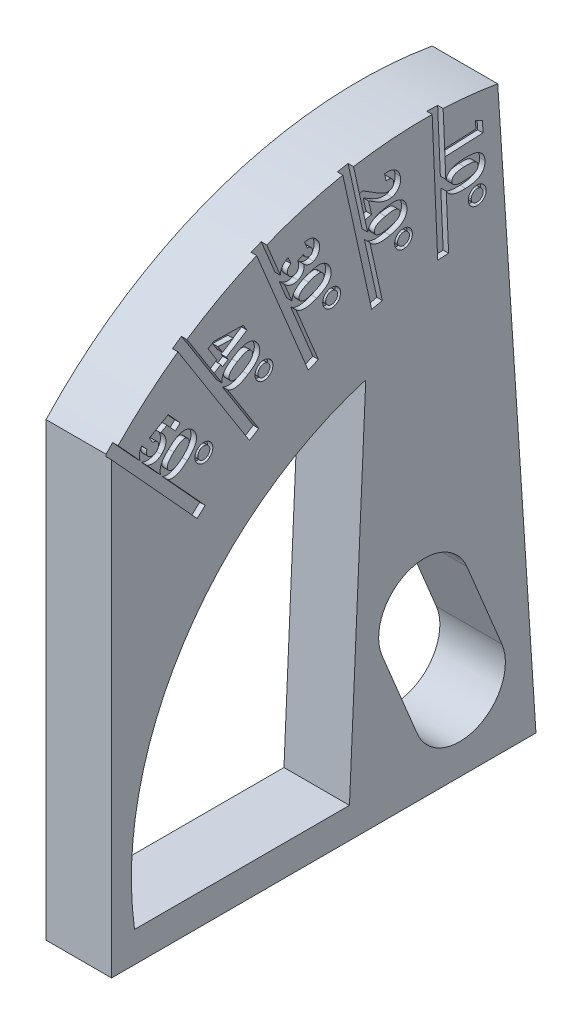
from build123d import *

# Parameters (mm, degrees)
BOSS_EXTRUDE6_DEPTH      = 3
BOSS_EXTRUDE7_START      = -3
BOSS_EXTRUDE7_DEPTH      = 3
CUT_EXTRUDE_THIN12_DEPTH = 0.5
CUT_EXTRUDE1_DEPTH       = 0.5


with BuildPart() as part:
    # Sketch2 → Boss-Extrude6 (new body)
    with BuildSketch(Plane(origin=(0, 0, 0), x_dir=(0, 0, -1), z_dir=(1, 0, 0))):
        with BuildLine():
            Line((0, 0), (-3.5, 53.242952677))
            ThreePointArc((-3.5, 53.242952677), (-22.706048147, 51.769808691), (-38.872614134, 41.296767928))
            Line((-38.872614134, 41.296767928), (-38.872614134, 0))
            Line((-38.872614134, 0), (0, 0))
        make_face()
        with BuildLine():
            Line((-17.081464763, 2.8), (-36.765140685, 2.8))
            ThreePointArc((-36.765140685, 2.8), (-32.300719913, 23.231979912), (-15.589274734, 35.806734621))
            Line((-15.589274734, 35.806734621), (-17.081464763, 2.8))
        make_face(mode=Mode.SUBTRACT)
        with BuildLine():
            Line((-10.88163695, 5.395975504), (-14.089685943, 13.159249405))
            ThreePointArc((-14.089685943, 13.159249405), (-11.812073489, 18.644910851), (-6.326412042, 16.367298397))
            Line((-6.326412042, 16.367298397), (-3.11836305, 8.604024496))
            ThreePointArc((-3.11836305, 8.604024496), (-5.395975504, 3.11836305), (-10.88163695, 5.395975504))
        make_face(mode=Mode.SUBTRACT)
    extrude(amount=BOSS_EXTRUDE6_DEPTH)

    # Sketch2<12> → Boss-Extrude7 (add)
    with BuildSketch(Plane(origin=(0, 0, 0), x_dir=(0, 0, -1), z_dir=(1, 0, 0)).offset(BOSS_EXTRUDE7_START)):
        with BuildLine():
            Line((0, 0), (-3.5, 53.242952677))
            ThreePointArc((-3.5, 53.242952677), (-22.706048147, 51.769808691), (-38.872614134, 41.296767928))
            Line((-38.872614134, 41.296767928), (-38.872614134, 0))
            Line((-38.872614134, 0), (0, 0))
        make_face()
        with BuildLine():
            Line((-17.081464763, 2.8), (-36.765140685, 2.8))
            ThreePointArc((-36.765140685, 2.8), (-32.300719913, 23.231979912), (-15.589274734, 35.806734621))
            Line((-15.589274734, 35.806734621), (-17.081464763, 2.8))
        make_face(mode=Mode.SUBTRACT)
        with BuildLine():
            Line((-10.88163695, 5.395975504), (-14.089685943, 13.159249405))
            ThreePointArc((-14.089685943, 13.159249405), (-11.812073489, 18.644910851), (-6.326412042, 16.367298397))
            Line((-6.326412042, 16.367298397), (-3.11836305, 8.604024496))
            ThreePointArc((-3.11836305, 8.604024496), (-5.395975504, 3.11836305), (-10.88163695, 5.395975504))
        make_face(mode=Mode.SUBTRACT)
        with BuildLine():
            Line((-32.189493943, 32.238592303), (-35.397542936, 40.001866204))
            ThreePointArc((-35.397542936, 40.001866204), (-35.483203292, 40.990491226), (-34.986320128, 41.849458193))
            ThreePointArc((-34.986320128, 41.849458193), (-24.227986914, 48.690629246), (-11.778642278, 51.439660538))
            ThreePointArc((-11.778642278, 51.439660538), (-10.820341068, 51.182025279), (-10.183120191, 50.421323835))
            Line((-10.183120191, 50.421323835), (-6.975071198, 42.658049934))
            ThreePointArc((-6.975071198, 42.658049934), (-7.869847519, 40.502968651), (-10.024928802, 41.397744973))
            Line((-10.024928802, 41.397744973), (-12.783719762, 48.073843096))
            ThreePointArc((-12.783719762, 48.073843096), (-14.129661882, 47.942319281), (-15.469178725, 47.756434009))
            Line((-15.469178725, 47.756434009), (-13.034813388, 41.865425198))
            ThreePointArc((-13.034813388, 41.865425198), (-13.929589709, 39.710343915), (-16.084670992, 40.605120237))
            Line((-16.084670992, 40.605120237), (-18.752910182, 47.062088852))
            ThreePointArc((-18.752910182, 47.062088852), (-20.098732658, 46.675692747), (-21.427183164, 46.233245754))
            Line((-21.427183164, 46.233245754), (-18.864856637, 40.032579024))
            ThreePointArc((-18.864856637, 40.032579024), (-19.759632958, 37.877497742), (-21.914714241, 38.772274063))
            Line((-21.914714241, 38.772274063), (-24.477040768, 44.972940793))
            ThreePointArc((-24.477040768, 44.972940793), (-25.730300615, 44.348537202), (-26.95629722, 43.672170132))
            Line((-26.95629722, 43.672170132), (-24.28805803, 37.215201516))
            ThreePointArc((-24.28805803, 37.215201516), (-25.182834352, 35.060120234), (-27.337915634, 35.954896555))
            Line((-27.337915634, 35.954896555), (-29.772280971, 41.845905366))
            ThreePointArc((-29.772280971, 41.845905366), (-30.852266161, 41.031970053), (-31.898427299, 40.174995388))
            Line((-31.898427299, 40.174995388), (-29.139636339, 33.498897264))
            ThreePointArc((-29.139636339, 33.498897264), (-30.03441266, 31.343815982), (-32.189493943, 32.238592303))
        make_face(mode=Mode.SUBTRACT)
    extrude(amount=BOSS_EXTRUDE7_DEPTH)

    # Sketch5 → Cut-Extrude-Thin12 (cut)
    with BuildSketch(Plane(origin=(3, 0, 0), x_dir=(0, 0, -1), z_dir=(1, 0, 0))):
        Polygon((-8.000457823, 42.049289353), (-8.550543025, 54.894841396), (-9.54962738, 54.852057597), (-8.999542177, 42.006505554), align=None)
        Polygon((-14.071503845, 41.343084215), (-16.95032166, 54.38018396), (-17.926798349, 54.164560965), (-15.047980534, 41.12746122), align=None)
        Polygon((-19.927685802, 39.593381841), (-25.066673517, 52.029404263), (-25.990872791, 51.647493669), (-20.851885076, 39.211471246), align=None)
        Polygon((-25.391066567, 36.853346053), (-33.213551063, 49.154879535), (-34.057391595, 48.618285501), (-26.234907098, 36.316752019), align=None)
        Polygon((-30.29564408, 33.206231451), (-39.663670285, 43.446820179), (-40.401512407, 42.771846844), (-31.033486202, 32.531258116), align=None)
    extrude(amount=-CUT_EXTRUDE_THIN12_DEPTH, mode=Mode.SUBTRACT)

    # Sketch6 → Cut-Extrude1 (cut)
    # profile 1 of 15: a face of its own
    with BuildSketch(Plane(origin=(3, 0, 0), x_dir=(0, 0, -1), z_dir=(1, 0, 0))):
        with BuildLine():
            add(Edge.make_bspline(
                [(-5.345315604, 44.525819217), (-5.373380319, 44.525233637), (-5.428695963, 44.524079458), (-5.510319116, 44.532481904), (-5.589276531, 44.546435636), (-5.664596885, 44.570401535), (-5.737465081, 44.600038488), (-5.806224663, 44.639423756), (-5.872619259, 44.685094088), (-5.935102124, 44.737927065), (-5.992183698, 44.796546448), (-6.043272631, 44.859200012), (-6.086476681, 44.925963781), (-6.123545483, 44.995618994), (-6.152221, 45.069139171), (-6.173958949, 45.145910284), (-6.18900351, 45.226192264), (-6.19303085, 45.281099892), (-6.19507522, 45.308972262)],
                knots=[0, 0, 0, 0, 1.045642652, 2.060965017, 3.053905051, 4.029604762, 5.002186716, 5.98142081, 6.977262396, 8.003703865, 9.026588495, 10.02410607, 11.012600996, 11.987015842, 12.961118949, 13.948576367, 14.958650391, 16, 16, 16, 16], degree=3))
            add(Edge.make_bspline(
                [(-6.19507522, 45.308972262), (-6.195620097, 45.336795583), (-6.196698496, 45.391862469), (-6.188815635, 45.473175536), (-6.173147713, 45.551491532), (-6.151020541, 45.626880553), (-6.120237155, 45.699060625), (-6.082600483, 45.768606895), (-6.036403155, 45.834634481), (-5.984224207, 45.897388003), (-5.92641589, 45.955300739), (-5.863984959, 46.006927954), (-5.797033848, 46.050155886), (-5.727050241, 46.087179437), (-5.653110627, 46.116899411), (-5.574936977, 46.138195311), (-5.493333915, 46.153556318), (-5.437464249, 46.156989822), (-5.409117688, 46.158731877)],
                knots=[0, 0, 0, 0, 1.034415282, 2.047276344, 3.030919915, 4.001728096, 4.963936583, 5.944194373, 6.937621881, 7.955988471, 8.976319413, 9.976908831, 10.963007487, 11.935060195, 12.918089037, 13.919885985, 14.944613731, 16, 16, 16, 16], degree=3))
            add(Edge.make_bspline(
                [(-5.409117688, 46.158731877), (-5.381762242, 46.159276768), (-5.327861696, 46.160350408), (-5.247888789, 46.152507286), (-5.170948684, 46.136217953), (-5.096436193, 46.112927467), (-5.024875301, 46.082154605), (-4.956048846, 46.043041715), (-4.890433115, 45.995825742), (-4.827670826, 45.942247286), (-4.769930008, 45.883120808), (-4.718589316, 45.820101916), (-4.674702185, 45.753605097), (-4.638102637, 45.683841928), (-4.608439317, 45.610875992), (-4.586873668, 45.534419399), (-4.571550691, 45.454899117), (-4.56811355, 45.400420715), (-4.56636929, 45.372774345)],
                knots=[0, 0, 0, 0, 1.024942141, 2.019522656, 3.003982417, 3.968160539, 4.941291001, 5.918120844, 6.929344212, 7.966936764, 9.007667892, 10.022829827, 11.009275369, 11.988890165, 12.971438238, 13.955742083, 14.962592366, 16, 16, 16, 16], degree=3))
            add(Edge.make_bspline(
                [(-4.56636929, 45.372774345), (-4.565813059, 45.345183404), (-4.564716957, 45.290813007), (-4.572698046, 45.210445733), (-4.588262329, 45.133037209), (-4.610604261, 45.058204227), (-4.640968305, 44.986292526), (-4.679285826, 44.917152742), (-4.724764076, 44.850660491), (-4.777280899, 44.787920837), (-4.834942632, 44.729832506), (-4.897534218, 44.678896897), (-4.962975145, 44.633897475), (-5.032553966, 44.59757702), (-5.105761675, 44.568685534), (-5.182140107, 44.546087727), (-5.262513414, 44.531066216), (-5.317442463, 44.527585479), (-5.345315604, 44.525819217)],
                knots=[0, 0, 0, 0, 1.033544654, 2.036691466, 3.019245838, 3.989068823, 4.958614903, 5.938667541, 6.946887236, 7.973019669, 9.001131432, 10.009351127, 10.993231958, 11.972697328, 12.943706158, 13.938713401, 14.954022777, 16, 16, 16, 16], degree=3))
        make_face()
        with BuildLine():
            add(Edge.make_bspline(
                [(-5.362142528, 44.806969057), (-5.342953459, 44.808318888), (-5.305326657, 44.810965699), (-5.250191386, 44.819747638), (-5.198084952, 44.835034646), (-5.148402051, 44.853587126), (-5.101111225, 44.877224149), (-5.056724651, 44.905702502), (-5.014812561, 44.939213316), (-4.975924551, 44.976831234), (-4.940543394, 45.017532164), (-4.910030397, 45.060769657), (-4.884608623, 45.105855652), (-4.864313576, 45.152904484), (-4.848714692, 45.201729335), (-4.838048505, 45.252437295), (-4.833200345, 45.305139042), (-4.833862898, 45.340750499), (-4.834197816, 45.358751909)],
                knots=[0, 0, 0, 0, 1.084091915, 2.125737031, 3.139009755, 4.13961661, 5.111635063, 6.112848689, 7.106494716, 8.13126147, 9.158564988, 10.141677369, 11.108953585, 12.070652602, 13.024652468, 13.993452308, 14.98570031, 16, 16, 16, 16], degree=3))
            add(Edge.make_bspline(
                [(-4.834197816, 45.358751909), (-4.835456462, 45.377258243), (-4.83792592, 45.413567603), (-4.848043, 45.466633916), (-4.86276816, 45.517368596), (-4.882326988, 45.565866174), (-4.907207024, 45.611817613), (-4.936807165, 45.655502826), (-4.971435069, 45.696940668), (-5.010133051, 45.735983627), (-5.052966081, 45.770416013), (-5.096874897, 45.801930232), (-5.143687329, 45.827068036), (-5.191928924, 45.847703228), (-5.242438789, 45.862137563), (-5.294380888, 45.873097322), (-5.348734871, 45.87787487), (-5.385509163, 45.877215979), (-5.404209835, 45.876880916)],
                knots=[0, 0, 0, 0, 1.038186986, 2.036919198, 3.018693185, 3.993460668, 4.959841948, 5.940131244, 6.944082824, 7.980783263, 9.013260198, 10.019172707, 11.003300131, 11.98306488, 12.952279091, 13.940663255, 14.952774413, 16, 16, 16, 16], degree=3))
            add(Edge.make_bspline(
                [(-5.404209835, 45.876880916), (-5.422481325, 45.875610179), (-5.458553482, 45.87310145), (-5.511389117, 45.863033851), (-5.562131807, 45.848325218), (-5.610790624, 45.828618072), (-5.657365611, 45.803692689), (-5.702258073, 45.774510468), (-5.74452589, 45.739677037), (-5.784130054, 45.700697964), (-5.820235464, 45.658609528), (-5.851227586, 45.614080268), (-5.877509279, 45.568192954), (-5.898655011, 45.520569882), (-5.914157219, 45.47088249), (-5.924504601, 45.41967211), (-5.93059716, 45.36683993), (-5.929768613, 45.33118873), (-5.92935006, 45.313178992)],
                knots=[0, 0, 0, 0, 1.027781484, 2.029078926, 3.013374587, 3.990645746, 4.971084159, 5.975730288, 6.992391186, 8.041075466, 9.093039455, 10.101535636, 11.083115268, 12.058534113, 13.021513149, 13.999577084, 14.989456455, 16, 16, 16, 16], degree=3))
            add(Edge.make_bspline(
                [(-5.92935006, 45.313178992), (-5.928100936, 45.295367322), (-5.92563528, 45.260208712), (-5.915271502, 45.208925521), (-5.901720209, 45.159296337), (-5.881635891, 45.112250154), (-5.857322165, 45.067144762), (-5.827105055, 45.025023676), (-5.79362909, 44.983771812), (-5.754465828, 44.945912259), (-5.712489155, 44.911066465), (-5.667572046, 44.881521553), (-5.621520151, 44.855726199), (-5.57268233, 44.836638354), (-5.522769411, 44.820488284), (-5.470675549, 44.811141871), (-5.416939383, 44.805877043), (-5.380616923, 44.806600892), (-5.362142528, 44.806969057)],
                knots=[0, 0, 0, 0, 1.01320629, 1.999976554, 2.966445373, 3.930449289, 4.898830917, 5.87111751, 6.870576164, 7.912594874, 8.959675232, 9.964848391, 10.962895381, 11.951450041, 12.938220304, 13.938031564, 14.951237854, 16, 16, 16, 16], degree=3))
        make_face(mode=Mode.SUBTRACT)
    # profile 2 of 15: a face of its own
    with BuildSketch(Plane(origin=(3, 0, 0), x_dir=(0, 0, -1), z_dir=(1, 0, 0))):
        with BuildLine():
            add(Edge.make_bspline(
                [(-4.667350427, 47.736554115), (-4.66643558, 47.705237736), (-4.664638826, 47.643732507), (-4.669638399, 47.55277244), (-4.68130806, 47.465084965), (-4.696686318, 47.379717987), (-4.720281876, 47.297866524), (-4.748921725, 47.218718324), (-4.784106046, 47.143080629), (-4.825013712, 47.070344528), (-4.871789046, 47.000875764), (-4.925562946, 46.935419403), (-4.985368073, 46.873534724), (-5.051566875, 46.81528118), (-5.124100876, 46.760270991), (-5.203411595, 46.709539818), (-5.288398866, 46.661572925), (-5.380330331, 46.617678763), (-5.480548442, 46.578692585), (-5.589398527, 46.542555007), (-5.708294912, 46.512199282), (-5.836526458, 46.485694903), (-5.974322805, 46.463417401), (-6.121632854, 46.445117978), (-6.278851083, 46.432193062), (-6.386952403, 46.42635683), (-6.442590811, 46.423352994)],
                knots=[0, 0, 0, 0, 0.899639577, 1.766888073, 2.612856802, 3.439671478, 4.255733596, 5.056381413, 5.855310708, 6.648834982, 7.451309962, 8.25756659, 9.078885422, 9.920688896, 10.788015332, 11.691104594, 12.62285565, 13.589711298, 14.614403302, 15.709792239, 16.882106226, 18.136787247, 19.469952052, 20.890441571, 22.399548856, 24, 24, 24, 24], degree=3))
            add(Edge.make_bspline(
                [(-6.442590811, 46.423352994), (-6.4989078, 46.421359968), (-6.608247888, 46.417490485), (-6.767474143, 46.417735647), (-6.917454978, 46.42182814), (-7.057932055, 46.433667838), (-7.189336241, 46.448247545), (-7.310967848, 46.469561632), (-7.423551876, 46.494970792), (-7.526926366, 46.526726975), (-7.622385689, 46.563055833), (-7.711331461, 46.601884219), (-7.794095337, 46.644874951), (-7.870236612, 46.691852594), (-7.940795948, 46.741599692), (-8.005126937, 46.79497368), (-8.062444899, 46.852603491), (-8.114231387, 46.913397994), (-8.160322622, 46.978074075), (-8.199278201, 47.048074728), (-8.233845341, 47.12206317), (-8.263506016, 47.200429027), (-8.286180189, 47.283687713), (-8.304658829, 47.370944293), (-8.317318858, 47.462803532), (-8.321082043, 47.525713904), (-8.322999465, 47.557768058)],
                knots=[0, 0, 0, 0, 1.626158069, 3.157204826, 4.594601382, 5.954574305, 7.224531527, 8.408778588, 9.516409375, 10.553295856, 11.526638002, 12.462791585, 13.352734156, 14.215686746, 15.042868512, 15.842535043, 16.62468756, 17.385524328, 18.145284102, 18.912432506, 19.693944987, 20.500719301, 21.327130776, 22.181660497, 23.073517887, 24, 24, 24, 24], degree=3))
            add(Edge.make_bspline(
                [(-8.322999465, 47.557768058), (-8.32392831, 47.589788204), (-8.325760031, 47.652933311), (-8.320540367, 47.74569379), (-8.310060445, 47.834923707), (-8.294101906, 47.920252588), (-8.272298306, 48.002363315), (-8.244475405, 48.08049598), (-8.210408556, 48.155069104), (-8.170350426, 48.22577783), (-8.12470852, 48.293550997), (-8.072555956, 48.357331007), (-8.014594815, 48.417949581), (-7.951015404, 48.475662395), (-7.880223143, 48.528606825), (-7.804481328, 48.579492935), (-7.72213133, 48.626349312), (-7.633237736, 48.670058016), (-7.536299555, 48.710529649), (-7.429687611, 48.74611217), (-7.312834952, 48.776333628), (-7.186446131, 48.804130951), (-7.049662587, 48.825898583), (-6.903079689, 48.844327927), (-6.746553953, 48.857214475), (-6.63892051, 48.863054949), (-6.583516292, 48.866061327)],
                knots=[0, 0, 0, 0, 0.93129915, 1.836561986, 2.699041506, 3.542892867, 4.359023757, 5.167390597, 5.952122213, 6.740407659, 7.528429323, 8.325660428, 9.133341146, 9.965948737, 10.819679272, 11.701939178, 12.618360987, 13.572860743, 14.581442944, 15.671203716, 16.838482196, 18.090344868, 19.433503553, 20.865043426, 22.386283937, 24, 24, 24, 24], degree=3))
            add(Edge.make_bspline(
                [(-6.583516292, 48.866061327), (-6.506403713, 48.868615773), (-6.357326883, 48.873554121), (-6.141549432, 48.869591927), (-5.941655416, 48.855050756), (-5.757981765, 48.831080789), (-5.590049858, 48.797038629), (-5.43827997, 48.753002446), (-5.301220206, 48.700396499), (-5.219807029, 48.65369323), (-5.180571581, 48.631185526)],
                knots=[0, 0, 0, 0, 1.284211067, 2.482683353, 3.59057499, 4.618915994, 5.564252552, 6.439593827, 7.24799354, 8, 8, 8, 8], degree=3))
            add(Edge.make_bspline(
                [(-5.180571581, 48.631185526), (-5.141817982, 48.604948305), (-5.06588819, 48.55354181), (-4.964931357, 48.462746728), (-4.878006548, 48.363593507), (-4.805633256, 48.255278526), (-4.748542477, 48.137981821), (-4.706545077, 48.011824903), (-4.677981577, 47.87723204), (-4.670946081, 47.784134026), (-4.667350427, 47.736554115)],
                knots=[0, 0, 0, 0, 1.04290939, 2.043368754, 3.018755753, 3.977323384, 4.940190434, 5.919386847, 6.936654135, 8, 8, 8, 8], degree=3))
        make_face()
        with BuildLine():
            add(Edge.make_bspline(
                [(-5.296256677, 47.691682321), (-5.298463681, 47.71898324), (-5.302827406, 47.772963061), (-5.327967537, 47.850146952), (-5.364634108, 47.922422462), (-5.407043843, 47.97667953), (-5.447692088, 48.01676595), (-5.483668983, 48.044643873), (-5.524158663, 48.070599444), (-5.568681328, 48.095555197), (-5.61923679, 48.11594247), (-5.673811793, 48.135858174), (-5.733374432, 48.153075309), (-5.79790056, 48.168687086), (-5.868509668, 48.182199099), (-5.946279671, 48.192202828), (-6.031588587, 48.200857904), (-6.124452229, 48.206216433), (-6.22475867, 48.208793279), (-6.332516009, 48.209396456), (-6.447768357, 48.208229255), (-6.527198337, 48.205108106), (-6.568091613, 48.203501231)],
                knots=[0, 0, 0, 0, 1.073689806, 2.122916962, 3.166818877, 4.247602806, 4.812947905, 5.408551116, 6.033015472, 6.703327974, 7.411616923, 8.173162382, 8.987333174, 9.8476465, 10.783012386, 11.812291906, 12.929647363, 14.15402832, 15.468606938, 16.874594235, 18.39093404, 20, 20, 20, 20], degree=3))
            add(Edge.make_bspline(
                [(-6.568091613, 48.203501231), (-6.620926624, 48.200511809), (-6.722497582, 48.194764892), (-6.868310575, 48.181994763), (-7.000918652, 48.163696382), (-7.120723021, 48.141891746), (-7.227330228, 48.114278125), (-7.321850219, 48.084347905), (-7.40317137, 48.048569818), (-7.472237024, 48.008348267), (-7.530083139, 47.964195325), (-7.580191538, 47.918414933), (-7.621410381, 47.869444147), (-7.655123195, 47.817927371), (-7.681512276, 47.764225555), (-7.698165197, 47.70704258), (-7.70773345, 47.647612729), (-7.707522067, 47.607116104), (-7.707414529, 47.586514051)],
                knots=[0, 0, 0, 0, 1.764558452, 3.392218262, 4.878936654, 6.226985854, 7.44986641, 8.54896119, 9.529311974, 10.406067407, 11.207177719, 11.95158799, 12.665005624, 13.335054176, 14.000783749, 14.651661095, 15.31405274, 16, 16, 16, 16], degree=3))
            add(Edge.make_bspline(
                [(-7.707414529, 47.586514051), (-7.705856852, 47.56680488), (-7.702818937, 47.528366391), (-7.689064256, 47.472616453), (-7.66803963, 47.420301162), (-7.638821369, 47.371648058), (-7.602734393, 47.326383119), (-7.559174771, 47.28474193), (-7.508883861, 47.245924358), (-7.47096553, 47.224508374), (-7.451505074, 47.213517256)],
                knots=[0, 0, 0, 0, 0.997262049, 1.944944644, 2.887540656, 3.835002663, 4.801034842, 5.802827864, 6.872366732, 8, 8, 8, 8], degree=3))
            add(Edge.make_bspline(
                [(-7.451505074, 47.213517256), (-7.425132479, 47.20048224), (-7.369770554, 47.17311885), (-7.276826258, 47.143484716), (-7.172880468, 47.117986696), (-7.056692551, 47.100040949), (-6.929039418, 47.085439883), (-6.789247013, 47.079411244), (-6.637706513, 47.07778895), (-6.532796588, 47.081291018), (-6.478348023, 47.083108603)],
                knots=[0, 0, 0, 0, 0.710846646, 1.492224761, 2.353461724, 3.298829183, 4.334106229, 5.460731249, 6.682111901, 8, 8, 8, 8], degree=3))
            add(Edge.make_bspline(
                [(-6.478348023, 47.083108603), (-6.42340042, 47.085992857), (-6.318053925, 47.091522599), (-6.166746972, 47.105643462), (-6.028921005, 47.123470431), (-5.904579181, 47.145572778), (-5.793784369, 47.172135231), (-5.696296048, 47.202411739), (-5.61196202, 47.237149232), (-5.540762484, 47.276979857), (-5.480476261, 47.320006439), (-5.429630226, 47.366060627), (-5.386259038, 47.413953419), (-5.350749889, 47.46429364), (-5.324515281, 47.517917335), (-5.306111205, 47.57352363), (-5.295798496, 47.631933789), (-5.296102252, 47.671544791), (-5.296256677, 47.691682321)],
                knots=[0, 0, 0, 0, 1.795716147, 3.442778086, 4.958489706, 6.330501321, 7.562648298, 8.6747679, 9.659347971, 10.5335908, 11.331637362, 12.071536026, 12.768344911, 13.436987734, 14.074903481, 14.709297963, 15.343830003, 16, 16, 16, 16], degree=3))
        make_face(mode=Mode.SUBTRACT)
    # profile 3 of 15: a face of its own
    with BuildSketch(Plane(origin=(3, 0, 0), x_dir=(0, 0, -1), z_dir=(1, 0, 0))):
        Polygon((-4.89593573, 51.01599895), (-4.852466178, 50.02391161), (-8.33353589, 49.871768181), (-8.362281883, 50.530121546), (-5.503808326, 50.654921226), (-5.535358807, 51.3714677), align=None)
    # profile 4 of 15: a face of its own
    with BuildSketch(Plane(origin=(3, 0, 0), x_dir=(0, 0, -1), z_dir=(1, 0, 0))):
        with BuildLine():
            add(Edge.make_bspline(
                [(-11.954307815, 44.481187286), (-11.981798856, 44.475685602), (-12.035748207, 44.464888909), (-12.117098686, 44.459061798), (-12.196501484, 44.459969477), (-12.274240915, 44.470140995), (-12.350354168, 44.487679457), (-12.424977457, 44.513191891), (-12.49826265, 44.546056504), (-12.568398021, 44.587466977), (-12.634742314, 44.634672682), (-12.695077685, 44.687512088), (-12.749879867, 44.744558714), (-12.797136285, 44.8069337), (-12.838636456, 44.873658141), (-12.872568953, 44.945328961), (-12.901219387, 45.021470596), (-12.914435636, 45.07464582), (-12.92115477, 45.101680074)],
                knots=[0, 0, 0, 0, 1.050430698, 2.061400888, 3.051915864, 4.023759774, 4.995327013, 5.97645301, 6.976691254, 8.001845898, 9.025763495, 10.025848141, 11.005328675, 11.986963423, 12.955006103, 13.946761064, 14.956134443, 16, 16, 16, 16], degree=3))
            add(Edge.make_bspline(
                [(-12.92115477, 45.101680074), (-12.926654705, 45.128936065), (-12.9374918, 45.182641383), (-12.943317356, 45.263542659), (-12.942159535, 45.342658446), (-12.932913451, 45.420164455), (-12.91622095, 45.496417485), (-12.890531021, 45.570948249), (-12.857641202, 45.644075547), (-12.816784329, 45.714421548), (-12.770732749, 45.781526941), (-12.717614513, 45.841759279), (-12.660352962, 45.896461536), (-12.598371393, 45.9448415), (-12.530547078, 45.985831604), (-12.458286047, 46.020814145), (-12.380967931, 46.050107161), (-12.326771952, 46.063254909), (-12.299259738, 46.069929273)],
                knots=[0, 0, 0, 0, 1.039318868, 2.047878289, 3.027289308, 3.995750704, 4.963066856, 5.941853251, 6.939706319, 7.958034189, 8.981603487, 9.979303321, 10.956448177, 11.94107487, 12.91426088, 13.915326422, 14.941729858, 16, 16, 16, 16], degree=3))
            add(Edge.make_bspline(
                [(-12.299259738, 46.069929273), (-12.272461128, 46.07511915), (-12.219637229, 46.08534914), (-12.139976833, 46.091603544), (-12.061695539, 46.089651184), (-11.984892677, 46.078889213), (-11.909496704, 46.060580969), (-11.835214704, 46.034408481), (-11.762454985, 46.000002441), (-11.692034246, 45.957888561), (-11.62513213, 45.910132033), (-11.564315042, 45.85683697), (-11.509524361, 45.79960431), (-11.461677962, 45.737516922), (-11.42013974, 45.670891015), (-11.38588047, 45.599504439), (-11.357379839, 45.524245694), (-11.344063486, 45.471790761), (-11.337320636, 45.445229754)],
                knots=[0, 0, 0, 0, 1.027718251, 2.025779922, 3.003438808, 3.97217639, 4.941673876, 5.921866792, 6.934080603, 7.968415296, 9.009324374, 10.026427766, 11.010409491, 11.989573749, 12.974185525, 13.962569172, 14.968329334, 16, 16, 16, 16], degree=3))
            add(Edge.make_bspline(
                [(-11.337320636, 45.445229754), (-11.332115917, 45.418432265), (-11.321812222, 45.365381719), (-11.315793516, 45.28547172), (-11.317140124, 45.206841393), (-11.32592434, 45.129651384), (-11.344047296, 45.05391558), (-11.369063751, 44.979586397), (-11.402664076, 44.906789752), (-11.442808392, 44.836061473), (-11.489208976, 44.769129855), (-11.541738081, 44.708410011), (-11.598309737, 44.653705516), (-11.659758006, 44.605174127), (-11.726982723, 44.565033042), (-11.797869969, 44.529368002), (-11.874147562, 44.501218977), (-11.927290151, 44.48793888), (-11.954307815, 44.481187286)],
                knots=[0, 0, 0, 0, 1.027903451, 2.034923531, 3.012560313, 3.987973566, 4.955604301, 5.941416667, 6.938414473, 7.97169798, 9.002614713, 10.0017104, 10.991957286, 11.96434476, 12.944516541, 13.936953723, 14.951148397, 16, 16, 16, 16], degree=3))
        make_face()
        with BuildLine():
            add(Edge.make_bspline(
                [(-12.01881102, 44.753923664), (-12.000247316, 44.758484626), (-11.963794768, 44.767440743), (-11.911694784, 44.786589225), (-11.862908438, 44.809903315), (-11.817552846, 44.837060608), (-11.775285414, 44.868316677), (-11.737168632, 44.90440727), (-11.700649256, 44.943411481), (-11.669915826, 44.987625759), (-11.642438669, 45.03365057), (-11.619852371, 45.081232433), (-11.60311852, 45.129986409), (-11.590814788, 45.179206376), (-11.584744874, 45.229572531), (-11.583135225, 45.280767027), (-11.587503361, 45.333153948), (-11.594084201, 45.367921838), (-11.597436821, 45.385634401)],
                knots=[0, 0, 0, 0, 1.083215186, 2.12705149, 3.140588093, 4.145075081, 5.120381139, 6.114323885, 7.118023897, 8.143958962, 9.159831803, 10.155716017, 11.123793471, 12.078353708, 13.026731316, 13.994445923, 14.978266969, 16, 16, 16, 16], degree=3))
            add(Edge.make_bspline(
                [(-11.597436821, 45.385634401), (-11.601699611, 45.403519244), (-11.610082696, 45.438691078), (-11.62959597, 45.488741577), (-11.652746638, 45.535930232), (-11.679971067, 45.580454863), (-11.712487831, 45.621153216), (-11.74931673, 45.658533339), (-11.790191875, 45.692982135), (-11.834710174, 45.724266629), (-11.88195213, 45.751632624), (-11.931251604, 45.773227999), (-11.981207868, 45.790179517), (-12.032078033, 45.802407724), (-12.084072229, 45.808711668), (-12.137131073, 45.809071576), (-12.191223277, 45.80532222), (-12.227102808, 45.798064136), (-12.24527336, 45.794388408)],
                knots=[0, 0, 0, 0, 1.034322884, 2.034070544, 3.017043897, 3.992232601, 4.966532751, 5.943762065, 6.943076465, 7.972783499, 9.004507262, 10.012107707, 10.998511427, 11.972189106, 12.95331037, 13.940504021, 14.957004795, 16, 16, 16, 16], degree=3))
            add(Edge.make_bspline(
                [(-12.24527336, 45.794388408), (-12.262920232, 45.790106013), (-12.297836499, 45.781632828), (-12.347658147, 45.762200729), (-12.394776112, 45.739303175), (-12.43889491, 45.71145885), (-12.48010852, 45.679167756), (-12.51888905, 45.642787124), (-12.554094028, 45.601313965), (-12.586893593, 45.556695702), (-12.61416418, 45.50855189), (-12.638147177, 45.459955868), (-12.655196645, 45.410104437), (-12.668412499, 45.35980905), (-12.675273697, 45.308496163), (-12.676712418, 45.256557227), (-12.672387229, 45.203941029), (-12.665797816, 45.169172573), (-12.662440828, 45.151459722)],
                knots=[0, 0, 0, 0, 1.024172897, 2.026438116, 3.011886787, 3.978337289, 4.96546287, 5.964160833, 6.974557103, 8.032921644, 9.08526497, 10.094454383, 11.087645984, 12.054096487, 13.026294376, 14.003048003, 14.982649313, 16, 16, 16, 16], degree=3))
            add(Edge.make_bspline(
                [(-12.662440828, 45.151459722), (-12.658058907, 45.134314496), (-12.649353974, 45.100254538), (-12.631291804, 45.051169104), (-12.608002442, 45.005430334), (-12.580161366, 44.962922131), (-12.548625364, 44.922916492), (-12.512853871, 44.885342747), (-12.471699367, 44.851891294), (-12.427288156, 44.821156386), (-12.379826208, 44.794713742), (-12.331061969, 44.772956973), (-12.281023512, 44.756532549), (-12.230303959, 44.745308999), (-12.1783399, 44.739749116), (-12.125787162, 44.73918667), (-12.072154154, 44.74300181), (-12.036746827, 44.750251359), (-12.01881102, 44.753923664)],
                knots=[0, 0, 0, 0, 1.009404051, 2.0052382, 2.9773952, 3.931734965, 4.900226201, 5.88112514, 6.885140954, 7.92089419, 8.959733603, 9.980700105, 10.963320001, 11.959957494, 12.939314067, 13.939603075, 14.956292801, 16, 16, 16, 16], degree=3))
        make_face(mode=Mode.SUBTRACT)
    # profile 5 of 15: a face of its own
    with BuildSketch(Plane(origin=(3, 0, 0), x_dir=(0, 0, -1), z_dir=(1, 0, 0))):
        with BuildLine():
            add(Edge.make_bspline(
                [(-11.847591589, 47.756943992), (-11.841251279, 47.726409241), (-11.828831252, 47.666594747), (-11.818907597, 47.576505921), (-11.813261372, 47.488707671), (-11.816001993, 47.402494374), (-11.822958923, 47.318462038), (-11.838329523, 47.236287276), (-11.858950587, 47.155992652), (-11.886665464, 47.077774239), (-11.920161088, 47.001426622), (-11.961801803, 46.928060569), (-12.009858416, 46.856998813), (-12.06380546, 46.7877565), (-12.125851296, 46.72195636), (-12.194919691, 46.658965618), (-12.270215529, 46.597758967), (-12.352529479, 46.538479609), (-12.443593446, 46.482164188), (-12.544317392, 46.42881168), (-12.655514886, 46.378572586), (-12.77682698, 46.330524641), (-12.907814843, 46.28397148), (-13.049386434, 46.241704789), (-13.2008475, 46.20082945), (-13.305842168, 46.176515986), (-13.3599113, 46.163995274)],
                knots=[0, 0, 0, 0, 0.900038495, 1.763084482, 2.614735483, 3.43832922, 4.251571976, 5.047149434, 5.84922663, 6.643228204, 7.440835382, 8.253657995, 9.075369356, 9.916473189, 10.785462038, 11.683423382, 12.614111914, 13.586139656, 14.61054681, 15.703444956, 16.875238751, 18.132206372, 19.470515088, 20.888101481, 22.397464776, 24, 24, 24, 24], degree=3))
            add(Edge.make_bspline(
                [(-13.3599113, 46.163995274), (-13.414769029, 46.152449069), (-13.521179011, 46.13005238), (-13.677377927, 46.102798866), (-13.825034875, 46.080963869), (-13.964807526, 46.068358911), (-14.095961323, 46.059539647), (-14.219110361, 46.059892285), (-14.333822724, 46.065831926), (-14.440698758, 46.078192856), (-14.540187, 46.097826417), (-14.633922691, 46.120520853), (-14.722277207, 46.147975482), (-14.805117418, 46.18002091), (-14.882340716, 46.217319818), (-14.954437312, 46.258817399), (-15.02095688, 46.304850137), (-15.081879741, 46.355877703), (-15.137662345, 46.411755157), (-15.189083105, 46.472787288), (-15.235141148, 46.53982126), (-15.27737426, 46.611363374), (-15.314920051, 46.688400096), (-15.346593631, 46.771215718), (-15.374956452, 46.858939309), (-15.389805948, 46.919699021), (-15.397371236, 46.950653928)],
                knots=[0, 0, 0, 0, 1.626777269, 3.155532341, 4.601015476, 5.956855002, 7.227359969, 8.414283478, 9.528274033, 10.559670297, 11.533366954, 12.469365494, 13.357474129, 14.216461671, 15.044611545, 15.843815502, 16.628380571, 17.389100867, 18.14685231, 18.917127428, 19.701692498, 20.504313896, 21.326358875, 22.185346416, 23.075498675, 24, 24, 24, 24], degree=3))
            add(Edge.make_bspline(
                [(-15.397371236, 46.950653928), (-15.403953622, 46.98188705), (-15.416900155, 47.043317765), (-15.427327443, 47.135296625), (-15.433795378, 47.224466446), (-15.431824844, 47.310931454), (-15.425401409, 47.394928275), (-15.411146922, 47.476269957), (-15.390742599, 47.555283052), (-15.364107536, 47.631772453), (-15.331010692, 47.706014417), (-15.290694088, 47.777528009), (-15.244510027, 47.847077131), (-15.191245407, 47.914124642), (-15.131855019, 47.979128276), (-15.065770406, 48.041696523), (-14.992825671, 48.101112978), (-14.914206249, 48.160316593), (-14.825740353, 48.215512817), (-14.727759438, 48.269095732), (-14.619073921, 48.320010706), (-14.499646677, 48.368237117), (-14.369753469, 48.413704811), (-14.22905276, 48.456257624), (-14.07796974, 48.496824799), (-13.973234593, 48.521239255), (-13.919406492, 48.533786941)],
                knots=[0, 0, 0, 0, 0.93234382, 1.833775952, 2.702956536, 3.54320722, 4.358890102, 5.162907222, 5.953140922, 6.741601469, 7.527365101, 8.325470785, 9.138173994, 9.964906799, 10.825483426, 11.709671175, 12.621830579, 13.574004503, 14.584026961, 15.666101714, 16.836355362, 18.089525003, 19.428876387, 20.857084192, 22.384714275, 24, 24, 24, 24], degree=3))
            add(Edge.make_bspline(
                [(-13.919406492, 48.533786941), (-13.844301068, 48.549771989), (-13.699351526, 48.580622297), (-13.486958531, 48.612461255), (-13.28883568, 48.633502571), (-13.10452318, 48.641746093), (-12.934376398, 48.637075526), (-12.778030203, 48.620991496), (-12.635280107, 48.591819253), (-12.547494888, 48.560689009), (-12.505243832, 48.545706012)],
                knots=[0, 0, 0, 0, 1.285539628, 2.481024265, 3.594322204, 4.620541929, 5.56798606, 6.441827773, 7.250051184, 8, 8, 8, 8], degree=3))
            add(Edge.make_bspline(
                [(-12.505243832, 48.545706012), (-12.462707005, 48.526533893), (-12.379282524, 48.488932968), (-12.26428291, 48.417735875), (-12.162269799, 48.33480219), (-12.072641033, 48.241301996), (-11.996146023, 48.136286686), (-11.932933995, 48.020248483), (-11.881702189, 47.893209882), (-11.859140479, 47.803079791), (-11.847591589, 47.756943992)],
                knots=[0, 0, 0, 0, 1.044352922, 2.048215789, 3.01954075, 3.982264166, 4.941422508, 5.920769918, 6.935683524, 8, 8, 8, 8], degree=3))
        make_face()
        with BuildLine():
            add(Edge.make_bspline(
                [(-12.456165307, 47.605501685), (-12.463505216, 47.631736522), (-12.47798062, 47.683475562), (-12.514165239, 47.755497149), (-12.563924006, 47.818724072), (-12.614097123, 47.864891796), (-12.660480698, 47.89769579), (-12.700314703, 47.919180624), (-12.744650205, 47.937353758), (-12.792750005, 47.953692204), (-12.845658536, 47.965869777), (-12.902713008, 47.976042152), (-12.964169761, 47.981593536), (-13.030067499, 47.986287518), (-13.101481183, 47.986933266), (-13.179317887, 47.982777989), (-13.264264462, 47.976865402), (-13.356156123, 47.966079445), (-13.454975847, 47.951098462), (-13.56064277, 47.932907927), (-13.673278905, 47.911000234), (-13.750462822, 47.894492168), (-13.790400082, 47.885950403)],
                knots=[0, 0, 0, 0, 1.075370998, 2.120793144, 3.161304103, 4.240281146, 4.804199101, 5.403705512, 6.024892002, 6.69690956, 7.409557064, 8.169060502, 8.986385829, 9.847454317, 10.780698827, 11.807333482, 12.928412414, 14.146707863, 15.463860203, 16.8795695, 18.385396206, 20, 20, 20, 20], degree=3))
            add(Edge.make_bspline(
                [(-13.790400082, 47.885950403), (-13.841676387, 47.874178511), (-13.940205013, 47.851558544), (-14.080526144, 47.812925361), (-14.20750667, 47.772745767), (-14.320972788, 47.729808074), (-14.421381129, 47.685657224), (-14.507965991, 47.638480929), (-14.582089943, 47.590580732), (-14.642369424, 47.538843455), (-14.691077633, 47.485207513), (-14.732412565, 47.431964363), (-14.765151717, 47.377250537), (-14.788191717, 47.320790002), (-14.805206213, 47.26385043), (-14.811855718, 47.204884055), (-14.810647646, 47.144932139), (-14.80358626, 47.105306935), (-14.800015467, 47.085269313)],
                knots=[0, 0, 0, 0, 1.763829033, 3.389238941, 4.878621937, 6.22775944, 7.455436049, 8.552999985, 9.531012413, 10.40901041, 11.207605476, 11.956767167, 12.666360276, 13.337255115, 13.997075275, 14.652178871, 15.31843555, 16, 16, 16, 16], degree=3))
            add(Edge.make_bspline(
                [(-14.800015467, 47.085269313), (-14.795187908, 47.066392559), (-14.785661303, 47.029141565), (-14.762069697, 46.977076438), (-14.732247611, 46.929531994), (-14.696305116, 46.886180062), (-14.653021319, 46.848249955), (-14.603154938, 46.815114642), (-14.547018177, 46.786146318), (-14.506209066, 46.771626389), (-14.485211781, 46.764155531)],
                knots=[0, 0, 0, 0, 0.988308675, 1.950307832, 2.889169356, 3.833196696, 4.800456712, 5.801520113, 6.868828396, 8, 8, 8, 8], degree=3))
            add(Edge.make_bspline(
                [(-14.485211781, 46.764155531), (-14.457076952, 46.756040532), (-14.398008224, 46.739003193), (-14.301926075, 46.725415252), (-14.195536664, 46.718320036), (-14.078626029, 46.720413782), (-13.951100185, 46.729769447), (-13.813115446, 46.746962962), (-13.66426026, 46.771299709), (-13.562210657, 46.793367916), (-13.509250242, 46.804820595)],
                knots=[0, 0, 0, 0, 0.711276465, 1.493316216, 2.353320199, 3.302439604, 4.333701817, 5.461518888, 6.682611134, 8, 8, 8, 8], degree=3))
            add(Edge.make_bspline(
                [(-13.509250242, 46.804820595), (-13.455863678, 46.81703262), (-13.35333736, 46.840485226), (-13.207527424, 46.88070121), (-13.075381066, 46.921611679), (-12.957282309, 46.964818382), (-12.853343712, 47.010307405), (-12.762897016, 47.056863881), (-12.686657001, 47.105761186), (-12.623751375, 47.156784587), (-12.57277689, 47.209845387), (-12.529317928, 47.262739133), (-12.495645852, 47.317907121), (-12.469638738, 47.37347657), (-12.45372251, 47.430377402), (-12.444706715, 47.487828535), (-12.445475571, 47.546807149), (-12.452560385, 47.585708004), (-12.456165307, 47.605501685)],
                knots=[0, 0, 0, 0, 1.795601415, 3.448365789, 4.958374661, 6.330708285, 7.569462546, 8.676637374, 9.662931344, 10.534274929, 11.325504244, 12.072326043, 12.77419006, 13.439498487, 14.077407954, 14.704921576, 15.341033268, 16, 16, 16, 16], degree=3))
        make_face(mode=Mode.SUBTRACT)
    # profile 6 of 15: a face of its own
    with BuildSketch(Plane(origin=(3, 0, 0), x_dir=(0, 0, -1), z_dir=(1, 0, 0))):
        with BuildLine():
            Line((-13.721544433, 50.656899417), (-13.86106767, 51.284403423))
            add(Edge.make_bspline(
                [(-13.86106767, 51.284403423), (-13.815818561, 51.291486581), (-13.727525364, 51.305307731), (-13.596592303, 51.31262372), (-13.471136693, 51.310137684), (-13.35064783, 51.29705382), (-13.235227949, 51.2726203), (-13.125335503, 51.236630639), (-13.020819241, 51.190028826), (-12.922241798, 51.133294686), (-12.830148976, 51.067550903), (-12.746802195, 50.992767107), (-12.670740106, 50.911288177), (-12.605023937, 50.82053013), (-12.546365774, 50.723023147), (-12.497144378, 50.617017902), (-12.457321591, 50.503147874), (-12.437409329, 50.423834148), (-12.427273599, 50.383461917)],
                knots=[0, 0, 0, 0, 1.159338069, 2.262180813, 3.316014621, 4.334378585, 5.326941114, 6.298383634, 7.257540978, 8.220016396, 9.174358562, 10.117623529, 11.051707176, 11.991679435, 12.949923209, 13.92967886, 14.946166193, 16, 16, 16, 16], degree=3))
            add(Edge.make_bspline(
                [(-12.427273599, 50.383461917), (-12.417516446, 50.333154534), (-12.398482683, 50.235017427), (-12.393053931, 50.087877262), (-12.403453594, 49.946173507), (-12.433776309, 49.810460287), (-12.482166291, 49.682053036), (-12.545792576, 49.560598439), (-12.629338545, 49.449497881), (-12.726566893, 49.348342325), (-12.834113626, 49.259541033), (-12.949223375, 49.188058569), (-13.068462901, 49.130942447), (-13.152479646, 49.10915223), (-13.194300843, 49.098305667)],
                knots=[0, 0, 0, 0, 1.106096203, 2.157716699, 3.171172583, 4.16994562, 5.151324058, 6.129760293, 7.122833219, 8.144563168, 9.156734298, 10.127986204, 11.068163634, 12, 12, 12, 12], degree=3))
            add(Edge.make_bspline(
                [(-13.194300843, 49.098305667), (-13.21971598, 49.093270976), (-13.271217216, 49.083068678), (-13.350691382, 49.074302549), (-13.432855724, 49.070165365), (-13.517644128, 49.070629263), (-13.604859703, 49.077616505), (-13.694826733, 49.087646981), (-13.787380373, 49.10427266), (-13.883413746, 49.125251789), (-13.983786094, 49.152683843), (-14.089060921, 49.188711816), (-14.199724597, 49.233552617), (-14.317174978, 49.284551962), (-14.440394101, 49.344269506), (-14.569218055, 49.412532181), (-14.704057797, 49.488373848), (-14.795088519, 49.542834059), (-14.841937061, 49.570861756)],
                knots=[0, 0, 0, 0, 0.707954995, 1.434600109, 2.18301938, 2.956036274, 3.750275602, 4.573580174, 5.429547723, 6.319250349, 7.259987938, 8.272113274, 9.35875285, 10.523081342, 11.771689449, 13.100481858, 14.507776328, 16, 16, 16, 16], degree=3))
            Line((-14.841937061, 49.570861756), (-15.326412221, 49.86112618))
            Line((-15.326412221, 49.86112618), (-15.059284817, 48.655897814))
            Line((-15.059284817, 48.655897814), (-15.655238343, 48.524086917))
            Line((-15.655238343, 48.524086917), (-16.174769593, 50.868638199))
            Line((-16.174769593, 50.868638199), (-15.866276003, 50.937348135))
            Line((-15.866276003, 50.937348135), (-14.567097317, 50.12685134))
            add(Edge.make_bspline(
                [(-14.567097317, 50.12685134), (-14.529381818, 50.103238195), (-14.456329733, 50.057501309), (-14.348358572, 49.995324474), (-14.248276843, 49.937345587), (-14.153414228, 49.888988187), (-14.065774639, 49.845364332), (-13.984149093, 49.810092422), (-13.909347027, 49.780465174), (-13.819796135, 49.752419055), (-13.715832418, 49.728101436), (-13.598268454, 49.712005151), (-13.489053719, 49.709636126), (-13.420666743, 49.721508078), (-13.387810458, 49.727211917)],
                knots=[0, 0, 0, 0, 1.256611003, 2.433960997, 3.518749539, 4.52249517, 5.44057065, 6.283019108, 7.033195904, 7.711645437, 8.931666009, 10.043488425, 11.060000809, 12, 12, 12, 12], degree=3))
            add(Edge.make_bspline(
                [(-13.387810458, 49.727211917), (-13.356735243, 49.735549504), (-13.296282063, 49.751769301), (-13.214931325, 49.796466156), (-13.146008078, 49.855221648), (-13.090690171, 49.927197298), (-13.049563298, 50.009167078), (-13.027091349, 50.099070068), (-13.022676729, 50.19473014), (-13.033660013, 50.258540462), (-13.039352926, 50.291614962)],
                knots=[0, 0, 0, 0, 1.036663175, 2.016706366, 2.970201169, 3.944553597, 4.930775328, 5.912562887, 6.918028666, 8, 8, 8, 8], degree=3))
            add(Edge.make_bspline(
                [(-13.039352926, 50.291614962), (-13.043752168, 50.308520193), (-13.052361441, 50.341603571), (-13.069743666, 50.389142213), (-13.092625496, 50.432850679), (-13.119186004, 50.473637748), (-13.15019721, 50.511353686), (-13.186444224, 50.544610172), (-13.225749478, 50.576184252), (-13.27012336, 50.602965427), (-13.317142755, 50.627069829), (-13.367717399, 50.6451505), (-13.420273191, 50.65904392), (-13.47552578, 50.669359387), (-13.533591657, 50.673148044), (-13.594252119, 50.672149754), (-13.657343165, 50.667610496), (-13.699853714, 50.660518208), (-13.721544433, 50.656899417)],
                knots=[0, 0, 0, 0, 0.970762875, 1.899773789, 2.806165112, 3.706953302, 4.601820446, 5.511649833, 6.436838016, 7.399395392, 8.387048361, 9.369304045, 10.37767187, 11.40715747, 12.488218826, 13.605514877, 14.778230236, 16, 16, 16, 16], degree=3))
        make_face()
    # profile 7 of 15: a face of its own
    with BuildSketch(Plane(origin=(3, 0, 0), x_dir=(0, 0, -1), z_dir=(1, 0, 0))):
        with BuildLine():
            add(Edge.make_bspline(
                [(-18.399468249, 43.127969206), (-18.425716275, 43.117923339), (-18.477493142, 43.098106857), (-18.557005082, 43.076765108), (-18.636546603, 43.065116146), (-18.715404768, 43.060839838), (-18.794214793, 43.063967624), (-18.872563908, 43.077136466), (-18.950880489, 43.097307864), (-19.02751228, 43.126173563), (-19.101344389, 43.161738003), (-19.170855537, 43.202846197), (-19.234736604, 43.250128942), (-19.291955365, 43.304006378), (-19.345433175, 43.362000077), (-19.391498345, 43.427521646), (-19.433254373, 43.497822283), (-19.455404632, 43.548383331), (-19.466575621, 43.573882668)],
                knots=[0, 0, 0, 0, 1.046323549, 2.063978261, 3.058628539, 4.034904052, 5.002057117, 5.989444566, 6.988047918, 8.009863315, 9.033752714, 10.036897948, 11.013522623, 11.986688971, 12.96040014, 13.9459443, 14.964082821, 16, 16, 16, 16], degree=3))
            add(Edge.make_bspline(
                [(-19.466575621, 43.573882668), (-19.476742006, 43.599866684), (-19.496852584, 43.651266815), (-19.516418368, 43.730479742), (-19.529835508, 43.809211971), (-19.533656776, 43.887742478), (-19.530393437, 43.966453473), (-19.518279185, 44.044643312), (-19.498418767, 44.122864827), (-19.470417173, 44.199732468), (-19.436124144, 44.27427922), (-19.394046304, 44.343353259), (-19.34721302, 44.407669841), (-19.293541364, 44.466149331), (-19.233700157, 44.518836975), (-19.167800907, 44.565977276), (-19.096565739, 44.608516869), (-19.04523628, 44.63100944), (-19.019259916, 44.642392283)],
                knots=[0, 0, 0, 0, 1.03597226, 2.049302613, 3.026048084, 4.000279903, 4.965408369, 5.94938795, 6.935320823, 7.960163509, 8.986036335, 9.979630089, 10.961191413, 11.938709014, 12.923340123, 13.918944089, 14.9468374, 16, 16, 16, 16], degree=3))
            add(Edge.make_bspline(
                [(-19.019259916, 44.642392283), (-18.993741329, 44.652321712), (-18.94326445, 44.671962555), (-18.86523196, 44.690945012), (-18.787400059, 44.70349256), (-18.709321459, 44.706861518), (-18.631041364, 44.701996972), (-18.552913992, 44.68829786), (-18.474650973, 44.667277703), (-18.397469145, 44.637946199), (-18.323229706, 44.60143816), (-18.252466677, 44.560716157), (-18.188825287, 44.512299665), (-18.129670327, 44.459925933), (-18.078174905, 44.400174708), (-18.030623888, 44.336509893), (-17.989697012, 44.266553388), (-17.967578469, 44.216804905), (-17.956359275, 44.191570969)],
                knots=[0, 0, 0, 0, 1.023486983, 2.024501908, 2.997787213, 3.969382001, 4.941920696, 5.926647851, 6.932083299, 7.969851754, 9.010122279, 10.025395881, 11.018743019, 11.996926029, 12.97581229, 13.963950034, 14.967253868, 16, 16, 16, 16], degree=3))
            add(Edge.make_bspline(
                [(-17.956359275, 44.191570969), (-17.946527458, 44.16579299), (-17.927135606, 44.114949613), (-17.906810766, 44.036966753), (-17.894840605, 43.958969905), (-17.890349666, 43.88097004), (-17.894914531, 43.802763029), (-17.90664468, 43.724468248), (-17.927441011, 43.646418132), (-17.955224498, 43.569189963), (-17.989731786, 43.494878064), (-18.030944285, 43.425620018), (-18.07708143, 43.361275937), (-18.130092593, 43.303115184), (-18.188328272, 43.249847974), (-18.253669849, 43.203911684), (-18.323686973, 43.161902973), (-18.37397097, 43.139386522), (-18.399468249, 43.127969206)],
                knots=[0, 0, 0, 0, 1.032570807, 2.036598216, 3.010696441, 3.983535836, 4.956375231, 5.939123232, 6.943150641, 7.975721448, 9.009330164, 10.005930723, 10.98973027, 11.968730291, 12.947730311, 13.938627596, 14.954749188, 16, 16, 16, 16], degree=3))
        make_face()
        with BuildLine():
            add(Edge.make_bspline(
                [(-18.511647736, 43.385982027), (-18.493927772, 43.393785763), (-18.459316926, 43.409028113), (-18.411494409, 43.437865232), (-18.366677622, 43.468588963), (-18.326115459, 43.503494579), (-18.290068166, 43.542435764), (-18.258450222, 43.584932154), (-18.230193448, 43.630525067), (-18.199047171, 43.695147253), (-18.171321207, 43.779194413), (-18.158907297, 43.882865846), (-18.168301709, 43.98722813), (-18.191841924, 44.052892179), (-18.203855268, 44.0864027)],
                knots=[0, 0, 0, 0, 0.817333059, 1.596424748, 2.355288363, 3.111512892, 3.852232162, 4.5928856, 5.346591204, 6.115096231, 7.620370964, 9.062108682, 10.500697572, 12, 12, 12, 12], degree=3))
            add(Edge.make_bspline(
                [(-18.203855268, 44.0864027), (-18.211206553, 44.103406387), (-18.225673306, 44.136868311), (-18.253314577, 44.183389874), (-18.285169408, 44.225621843), (-18.320393124, 44.264317704), (-18.358960343, 44.299850668), (-18.402190674, 44.330439428), (-18.448578614, 44.358265112), (-18.515126387, 44.388175254), (-18.601299529, 44.415842428), (-18.707931142, 44.426467321), (-18.815190927, 44.415616609), (-18.882922517, 44.391246569), (-18.917597255, 44.378770489)],
                knots=[0, 0, 0, 0, 0.776911007, 1.528899986, 2.264590056, 2.993711332, 3.722832609, 4.46061234, 5.21260132, 5.989512326, 7.519150199, 8.988108743, 10.458082224, 12, 12, 12, 12], degree=3))
            add(Edge.make_bspline(
                [(-18.917597255, 44.378770489), (-18.934363684, 44.371403511), (-18.967546899, 44.356823184), (-19.013650741, 44.32923485), (-19.056330101, 44.298220586), (-19.095060986, 44.262688559), (-19.130736535, 44.223696422), (-19.162741385, 44.180611769), (-19.189661959, 44.133087678), (-19.222284103, 44.067266112), (-19.25001723, 43.980591335), (-19.263523302, 43.874703553), (-19.253986544, 43.768638067), (-19.230381741, 43.702278496), (-19.218378505, 43.66853411)],
                knots=[0, 0, 0, 0, 0.770181796, 1.524302488, 2.256218171, 2.987406336, 3.732490678, 4.478159222, 5.240765275, 6.02827903, 7.568171394, 9.044542075, 10.497125411, 12, 12, 12, 12], degree=3))
            add(Edge.make_bspline(
                [(-19.218378505, 43.66853411), (-19.21097372, 43.652249825), (-19.196363016, 43.62011859), (-19.169354329, 43.575190208), (-19.139453436, 43.533349422), (-19.104350048, 43.495987818), (-19.066091691, 43.461676684), (-19.023679198, 43.431086708), (-18.976865138, 43.405586755), (-18.911720859, 43.374658334), (-18.825560767, 43.349228971), (-18.719681952, 43.339076275), (-18.613173334, 43.34979545), (-18.545866956, 43.373785335), (-18.511647736, 43.385982027)],
                knots=[0, 0, 0, 0, 0.761398935, 1.502349467, 2.229121047, 2.94766476, 3.680952166, 4.415792077, 5.169012483, 5.948419963, 7.485468059, 8.96536158, 10.457160201, 12, 12, 12, 12], degree=3))
        make_face(mode=Mode.SUBTRACT)
    # profile 8 of 15: a face of its own
    with BuildSketch(Plane(origin=(3, 0, 0), x_dir=(0, 0, -1), z_dir=(1, 0, 0))):
        with BuildLine():
            add(Edge.make_bspline(
                [(-18.859389395, 46.377720584), (-18.848037168, 46.348640719), (-18.825660167, 46.291319792), (-18.798904668, 46.204227216), (-18.779377966, 46.117697234), (-18.765649035, 46.032006245), (-18.759611831, 45.947111412), (-18.759268857, 45.862950349), (-18.766512671, 45.77973746), (-18.779803734, 45.69718478), (-18.799776153, 45.615790529), (-18.82865998, 45.536237079), (-18.862857276, 45.457186344), (-18.904853935, 45.37938954), (-18.955373195, 45.303528983), (-19.01206731, 45.228424164), (-19.076162826, 45.154787784), (-19.147546999, 45.081946326), (-19.227694614, 45.009978901), (-19.319005418, 44.940166681), (-19.419691659, 44.86982179), (-19.531923406, 44.801580245), (-19.653604572, 44.732544245), (-19.786768873, 44.665826718), (-19.929430609, 44.598003411), (-20.029381952, 44.556036671), (-20.080743562, 44.534471386)],
                knots=[0, 0, 0, 0, 0.895415096, 1.765002071, 2.610818394, 3.438691444, 4.252239922, 5.050137216, 5.850846789, 6.645610799, 7.447330377, 8.251066159, 9.070753051, 9.916781957, 10.783391108, 11.683213688, 12.614849515, 13.582093574, 14.607764298, 15.702162301, 16.877665199, 18.129996958, 19.468987796, 20.890341182, 22.402051681, 24, 24, 24, 24], degree=3))
            add(Edge.make_bspline(
                [(-20.080743562, 44.534471386), (-20.132975743, 44.513369086), (-20.23456635, 44.472325512), (-20.384575746, 44.417511123), (-20.527449365, 44.371130801), (-20.663338043, 44.332943373), (-20.792015323, 44.302836899), (-20.913802227, 44.279794147), (-21.028551951, 44.265590694), (-21.136805301, 44.259828801), (-21.238862923, 44.261649985), (-21.335787905, 44.267625775), (-21.428220088, 44.279156424), (-21.515749284, 44.298123216), (-21.599422683, 44.319539483), (-21.677816796, 44.348838572), (-21.751469413, 44.383390326), (-21.821557336, 44.422232943), (-21.886240507, 44.468872478), (-21.948350536, 44.5196578), (-22.005947967, 44.577770487), (-22.060044563, 44.641805494), (-22.110516838, 44.711860999), (-22.156695517, 44.788382497), (-22.200523554, 44.86998318), (-22.225430905, 44.927833294), (-22.238095325, 44.957247828)],
                knots=[0, 0, 0, 0, 1.623791398, 3.158243607, 4.602685521, 5.952820748, 7.225789965, 8.411025754, 9.524045548, 10.556183345, 11.533111652, 12.464764476, 13.354684746, 14.214807638, 15.044965683, 15.842131045, 16.622727734, 17.388977177, 18.147846648, 18.918113154, 19.699349128, 20.502413617, 21.332544327, 22.185221504, 23.077255692, 24, 24, 24, 24], degree=3))
            add(Edge.make_bspline(
                [(-22.238095325, 44.957247828), (-22.249958709, 44.987248396), (-22.273161478, 45.045924424), (-22.300440381, 45.135049788), (-22.321756056, 45.222538563), (-22.335876423, 45.308801777), (-22.342810035, 45.393435489), (-22.343785763, 45.476660943), (-22.337482124, 45.558540236), (-22.324156318, 45.639033432), (-22.303408272, 45.717908616), (-22.276822536, 45.796094525), (-22.243080913, 45.873263723), (-22.202200617, 45.949172624), (-22.154360135, 46.023693872), (-22.099215849, 46.096575646), (-22.038016162, 46.168999181), (-21.969911629, 46.241180579), (-21.891756202, 46.311501742), (-21.80420523, 46.381934072), (-21.704517027, 46.45030458), (-21.594603085, 46.518898638), (-21.473803039, 46.586811645), (-21.342163573, 46.653953885), (-21.200123949, 46.721657248), (-21.100358839, 46.763518987), (-21.048992761, 46.785072347)],
                knots=[0, 0, 0, 0, 0.936176269, 1.831002135, 2.703113772, 3.548534891, 4.365465839, 5.166035171, 5.962136443, 6.7462082, 7.531101344, 8.327058067, 9.141280201, 9.972951934, 10.827335604, 11.709287097, 12.623978078, 13.578918919, 14.587469037, 15.673477687, 16.838413277, 18.094011392, 19.433671645, 20.859734859, 22.383171164, 24, 24, 24, 24], degree=3))
            add(Edge.make_bspline(
                [(-21.048992761, 46.785072347), (-20.977244111, 46.81373459), (-20.838500894, 46.869159909), (-20.634139184, 46.939275402), (-20.441478237, 46.994942365), (-20.260105365, 47.034159974), (-20.090616288, 47.060510909), (-19.932515934, 47.070374811), (-19.785897679, 47.067201019), (-19.693375195, 47.05139317), (-19.648852536, 47.04378629)],
                knots=[0, 0, 0, 0, 1.284720852, 2.484315811, 3.59155448, 4.617647219, 5.568555395, 6.440853287, 7.24972446, 8, 8, 8, 8], degree=3))
            add(Edge.make_bspline(
                [(-19.648852536, 47.04378629), (-19.60316372, 47.032531155), (-19.513853235, 47.010530113), (-19.387852837, 46.958876193), (-19.272271749, 46.895225062), (-19.167301768, 46.817988523), (-19.073301228, 46.72741024), (-18.990261885, 46.623322185), (-18.917348016, 46.506387165), (-18.878984411, 46.421220994), (-18.859389395, 46.377720584)],
                knots=[0, 0, 0, 0, 1.046836795, 2.046310445, 3.022593966, 3.979366106, 4.940207591, 5.921418793, 6.938321006, 8, 8, 8, 8], degree=3))
        make_face()
        with BuildLine():
            add(Edge.make_bspline(
                [(-19.436412632, 46.120408886), (-19.448246658, 46.145152889), (-19.471552827, 46.193884231), (-19.520135083, 46.259196153), (-19.580771891, 46.313151828), (-19.65135169, 46.358754259), (-19.735726547, 46.391458681), (-19.834559361, 46.409113834), (-19.948007615, 46.410307385), (-20.051629461, 46.401407984), (-20.142911542, 46.385269421), (-20.219849246, 46.369633833), (-20.302681049, 46.347271962), (-20.391782217, 46.320694437), (-20.486965127, 46.288771128), (-20.588927316, 46.253313719), (-20.696748097, 46.211671766), (-20.770465823, 46.181534296), (-20.808507985, 46.165981802)],
                knots=[0, 0, 0, 0, 0.860532589, 1.694750343, 2.536977699, 3.398700123, 4.321904117, 5.360347558, 6.535667437, 7.877330893, 8.622212084, 9.447460892, 10.34339247, 11.316864278, 12.368825388, 13.497569569, 14.708616365, 16, 16, 16, 16], degree=3))
            add(Edge.make_bspline(
                [(-20.808507985, 46.165981802), (-20.857299634, 46.145352987), (-20.950963856, 46.105752319), (-21.082876114, 46.042325675), (-21.201589557, 45.980129048), (-21.307106697, 45.918843654), (-21.398780135, 45.857380872), (-21.476228797, 45.795521841), (-21.541103565, 45.734722467), (-21.592046514, 45.673051199), (-21.632115386, 45.612002833), (-21.662113059, 45.551225228), (-21.685560049, 45.491425273), (-21.698602751, 45.431069708), (-21.704559352, 45.371265322), (-21.701893097, 45.311676558), (-21.689625648, 45.25274079), (-21.67580828, 45.214876822), (-21.668784427, 45.195629238)],
                knots=[0, 0, 0, 0, 1.764439637, 3.387154782, 4.874174428, 6.228106891, 7.45028074, 8.546991226, 9.527140043, 10.406331717, 11.205306021, 11.953873309, 12.660968752, 13.339053235, 14.003731323, 14.658440627, 15.318038298, 16, 16, 16, 16], degree=3))
            add(Edge.make_bspline(
                [(-21.668784427, 45.195629238), (-21.660642751, 45.177601193), (-21.644727216, 45.142359558), (-21.612508011, 45.094590081), (-21.5743121, 45.053252758), (-21.531034024, 45.01667251), (-21.481436916, 44.986671957), (-21.426425381, 44.961939548), (-21.365541855, 44.943710233), (-21.32276157, 44.93645224), (-21.300695485, 44.932708565)],
                knots=[0, 0, 0, 0, 0.997489284, 1.949914751, 2.893748055, 3.83203218, 4.801485353, 5.810357433, 6.870581599, 8, 8, 8, 8], degree=3))
            add(Edge.make_bspline(
                [(-21.300695485, 44.932708565), (-21.271279022, 44.929372281), (-21.209753127, 44.922394287), (-21.112045157, 44.927235268), (-21.005300091, 44.937716289), (-20.889814135, 44.960580818), (-20.76490037, 44.991270021), (-20.63158898, 45.033649977), (-20.487954742, 45.08274846), (-20.390680656, 45.122433542), (-20.340158626, 45.143045104)],
                knots=[0, 0, 0, 0, 0.714078657, 1.493528598, 2.356434023, 3.304292513, 4.334015823, 5.4626427, 6.682152194, 8, 8, 8, 8], degree=3))
            add(Edge.make_bspline(
                [(-20.340158626, 45.143045104), (-20.289514416, 45.16440946), (-20.191956222, 45.20556457), (-20.054532527, 45.270557885), (-19.930812866, 45.334456447), (-19.821488559, 45.397709929), (-19.726351473, 45.461148408), (-19.644585326, 45.522625646), (-19.577796526, 45.584862116), (-19.524434132, 45.646421638), (-19.48238632, 45.707519384), (-19.449957625, 45.768077548), (-19.42561873, 45.82817968), (-19.409868721, 45.88776634), (-19.403455278, 45.947090325), (-19.405619514, 46.005621305), (-19.416031832, 46.064058609), (-19.42954022, 46.101407555), (-19.436412632, 46.120408886)],
                knots=[0, 0, 0, 0, 1.791468217, 3.450984909, 4.953556594, 6.329336354, 7.565315375, 8.679097613, 9.65998505, 10.534999347, 11.329476612, 12.07243216, 12.769820737, 13.438666425, 14.074646191, 14.707332598, 15.342353566, 16, 16, 16, 16], degree=3))
        make_face(mode=Mode.SUBTRACT)
    # profile 9 of 15: a face of its own
    with BuildSketch(Plane(origin=(3, 0, 0), x_dir=(0, 0, -1), z_dir=(1, 0, 0))):
        with BuildLine():
            Line((-20.944510862, 48.938269238), (-21.189202368, 49.527912668))
            add(Edge.make_bspline(
                [(-21.189202368, 49.527912668), (-21.158200661, 49.53551133), (-21.09749177, 49.550391362), (-21.006692117, 49.566314782), (-20.918025239, 49.57357501), (-20.831518668, 49.575693133), (-20.747354092, 49.568931281), (-20.66547561, 49.556482886), (-20.585779343, 49.537089233), (-20.534666436, 49.518350293), (-20.509114227, 49.508982379)],
                knots=[0, 0, 0, 0, 1.106411743, 2.166623579, 3.19132333, 4.187966912, 5.162904097, 6.113951069, 7.057132142, 8, 8, 8, 8], degree=3))
            add(Edge.make_bspline(
                [(-20.509114227, 49.508982379), (-20.474651291, 49.494262764), (-20.406652764, 49.465219617), (-20.311339972, 49.409710157), (-20.223419174, 49.345867996), (-20.143093409, 49.273199103), (-20.070194124, 49.192080136), (-20.005958466, 49.10156389), (-19.947515255, 49.003201457), (-19.916400118, 48.932327099), (-19.900540509, 48.89620193)],
                knots=[0, 0, 0, 0, 1.011419701, 1.995623651, 2.97163533, 3.941483073, 4.91602387, 5.911079305, 6.935262152, 8, 8, 8, 8], degree=3))
            add(Edge.make_bspline(
                [(-19.900540509, 48.89620193), (-19.887790318, 48.863455539), (-19.862814457, 48.799309892), (-19.836043474, 48.700914972), (-19.819210408, 48.603222873), (-19.811490421, 48.506304372), (-19.812418403, 48.409952481), (-19.824771489, 48.314636383), (-19.846105868, 48.219895316), (-19.875709603, 48.126776633), (-19.914386032, 48.038020927), (-19.958021841, 47.954485695), (-20.009830081, 47.879178906), (-20.067450987, 47.810414966), (-20.13233283, 47.749546178), (-20.202994735, 47.694943373), (-20.280191862, 47.647491588), (-20.335858099, 47.622812849), (-20.363982016, 47.610344559)],
                knots=[0, 0, 0, 0, 1.109216163, 2.172800933, 3.213918902, 4.235706328, 5.239609915, 6.251216719, 7.264733461, 8.303441673, 9.331712991, 10.319009777, 11.275050159, 12.212533824, 13.147107487, 14.078645107, 15.02928546, 16, 16, 16, 16], degree=3))
            add(Edge.make_bspline(
                [(-20.363982016, 47.610344559), (-20.39963765, 47.59705095), (-20.470060635, 47.570794917), (-20.581241004, 47.551496395), (-20.693411162, 47.548810111), (-20.806320402, 47.562220569), (-20.918516526, 47.5923822), (-21.027562699, 47.641067542), (-21.134277328, 47.705400133), (-21.19966731, 47.759263167), (-21.233373041, 47.787027251)],
                knots=[0, 0, 0, 0, 0.97238609, 1.920547223, 2.872042949, 3.8359453, 4.821310518, 5.833885201, 6.883460723, 8, 8, 8, 8], degree=3))
            add(Edge.make_bspline(
                [(-21.233373041, 47.787027251), (-21.231103542, 47.759936014), (-21.226628476, 47.706516713), (-21.226907299, 47.627309081), (-21.232078056, 47.550351956), (-21.244529884, 47.475954792), (-21.260952862, 47.403317284), (-21.284054074, 47.333054485), (-21.314059927, 47.265695382), (-21.348025369, 47.200514234), (-21.387544977, 47.1386853), (-21.431396394, 47.080354795), (-21.480883985, 47.027001791), (-21.534575414, 46.977855389), (-21.591867563, 46.931745924), (-21.655070348, 46.89138089), (-21.721915916, 46.853759805), (-21.769524837, 46.83331186), (-21.793569355, 46.822984783)],
                knots=[0, 0, 0, 0, 1.085122072, 2.13967576, 3.159636202, 4.161504694, 5.148484452, 6.131219496, 7.109112685, 8.090118068, 9.063548007, 10.035993281, 11.00025413, 11.96451498, 12.941026743, 13.932408752, 14.955779017, 16, 16, 16, 16], degree=3))
            add(Edge.make_bspline(
                [(-21.793569355, 46.822984783), (-21.829538678, 46.809115976), (-21.900179949, 46.781878594), (-22.009405101, 46.75487032), (-22.118294661, 46.737998612), (-22.227693104, 46.734964483), (-22.336666813, 46.742661384), (-22.445861731, 46.761540679), (-22.554580113, 46.793773732), (-22.662606553, 46.83622646), (-22.767298821, 46.88880009), (-22.86515174, 46.95254636), (-22.956330187, 47.025022747), (-23.039868842, 47.10756539), (-23.116569139, 47.199158621), (-23.186097284, 47.299782605), (-23.248396832, 47.409823755), (-23.282737718, 47.48825052), (-23.300280093, 47.528313309)],
                knots=[0, 0, 0, 0, 0.994834799, 1.953786987, 2.899673899, 3.835802752, 4.773798109, 5.717583198, 6.691859086, 7.697350303, 8.712399465, 9.711984476, 10.708447858, 11.715821748, 12.739895018, 13.78977772, 14.870950916, 16, 16, 16, 16], degree=3))
            add(Edge.make_bspline(
                [(-23.300280093, 47.528313309), (-23.315545805, 47.566844636), (-23.345462237, 47.642355019), (-23.376332691, 47.757954056), (-23.398051177, 47.871091978), (-23.407967639, 47.982661), (-23.406707121, 48.092621903), (-23.393810397, 48.200851851), (-23.370842706, 48.307694407), (-23.335658661, 48.411696048), (-23.289963323, 48.512164352), (-23.234565966, 48.607543268), (-23.169552227, 48.697514712), (-23.094254935, 48.781092664), (-23.008484712, 48.858390729), (-22.9137929, 48.930793582), (-22.808787328, 48.99701592), (-22.733634922, 49.035155798), (-22.695211984, 49.054655456)],
                knots=[0, 0, 0, 0, 1.083191458, 2.122745461, 3.123846439, 4.093453392, 5.047129032, 5.994909237, 6.939727931, 7.900449786, 8.860646427, 9.82206812, 10.780687396, 11.758926888, 12.75853374, 13.796522976, 14.87343511, 16, 16, 16, 16], degree=3))
            Line((-22.695211984, 49.054655456), (-22.443509259, 48.448185103))
            add(Edge.make_bspline(
                [(-22.443509259, 48.448185103), (-22.462392486, 48.436305251), (-22.499087298, 48.41321974), (-22.549668906, 48.37492939), (-22.595539621, 48.336007881), (-22.635347034, 48.294968778), (-22.67125389, 48.253734401), (-22.700270221, 48.209968163), (-22.725454979, 48.165759486), (-22.75024385, 48.105192885), (-22.770140257, 48.026303043), (-22.773681504, 47.928253474), (-22.760078181, 47.827129578), (-22.735813627, 47.762354754), (-22.723256855, 47.728834142)],
                knots=[0, 0, 0, 0, 0.940417167, 1.827464784, 2.673080086, 3.474580379, 4.236819659, 4.974908138, 5.685230352, 6.378947492, 7.729554788, 9.090979437, 10.494598011, 12, 12, 12, 12], degree=3))
            add(Edge.make_bspline(
                [(-22.723256855, 47.728834142), (-22.715672025, 47.711360704), (-22.700866803, 47.677253395), (-22.672877162, 47.629859885), (-22.642179758, 47.586444066), (-22.608160821, 47.546527967), (-22.570617122, 47.51093003), (-22.529312318, 47.480079088), (-22.485626984, 47.4520719), (-22.42310891, 47.422281368), (-22.341709082, 47.395233606), (-22.240760041, 47.384892952), (-22.138921407, 47.393969867), (-22.074591008, 47.417001924), (-22.041766471, 47.428754014)],
                knots=[0, 0, 0, 0, 0.824782909, 1.609936515, 2.379919828, 3.126913365, 3.879174952, 4.616493788, 5.358320141, 6.12382774, 7.613173221, 9.04925851, 10.494386393, 12, 12, 12, 12], degree=3))
            add(Edge.make_bspline(
                [(-22.041766471, 47.428754014), (-22.024021409, 47.436746158), (-21.989115217, 47.452467451), (-21.941118658, 47.483013984), (-21.897767511, 47.518726277), (-21.858383305, 47.559004877), (-21.824720845, 47.60543902), (-21.79498223, 47.65600602), (-21.770526072, 47.712141921), (-21.750250949, 47.77282196), (-21.7353068, 47.838043928), (-21.728035726, 47.906956919), (-21.726485835, 47.978994722), (-21.732335768, 48.054322284), (-21.745363325, 48.132967262), (-21.764295132, 48.215239232), (-21.790321916, 48.30065077), (-21.811935243, 48.357857446), (-21.823016471, 48.387187507)],
                knots=[0, 0, 0, 0, 0.851171954, 1.674334657, 2.481315047, 3.30619274, 4.132908497, 4.985739118, 5.86978921, 6.808065796, 7.783537828, 8.79250651, 9.836304659, 10.934114534, 12.094730143, 13.323259083, 14.62762562, 16, 16, 16, 16], degree=3))
            Line((-21.823016471, 48.387187507), (-21.297175125, 48.604535264))
            add(Edge.make_bspline(
                [(-21.297175125, 48.604535264), (-21.279584116, 48.571356553), (-21.246742132, 48.509412711), (-21.19483937, 48.425994794), (-21.144651217, 48.358023012), (-21.094970215, 48.304191271), (-21.043342213, 48.26404428), (-20.991207995, 48.232079643), (-20.936875912, 48.207724332), (-20.880526296, 48.192605949), (-20.824173216, 48.184520115), (-20.768717424, 48.185518884), (-20.714771746, 48.193245092), (-20.680958196, 48.205689034), (-20.664062144, 48.211907059)],
                knots=[0, 0, 0, 0, 1.634451518, 3.051481064, 4.272322573, 5.308640526, 6.228613437, 7.10973864, 7.966082066, 8.81019095, 9.641823112, 10.435435306, 11.218213815, 12, 12, 12, 12], degree=3))
            add(Edge.make_bspline(
                [(-20.664062144, 48.211907059), (-20.643538823, 48.221916723), (-20.603559932, 48.241415288), (-20.551539156, 48.282758487), (-20.511969112, 48.334799597), (-20.482295777, 48.393894326), (-20.464563491, 48.459223171), (-20.461319117, 48.528682739), (-20.472059721, 48.600568487), (-20.489087966, 48.647081659), (-20.497896278, 48.671141834)],
                knots=[0, 0, 0, 0, 1.000214448, 1.948391542, 2.883837852, 3.846982455, 4.834604439, 5.830709482, 6.87787676, 8, 8, 8, 8], degree=3))
            add(Edge.make_bspline(
                [(-20.497896278, 48.671141834), (-20.507701604, 48.692344521), (-20.527142702, 48.734383257), (-20.568711205, 48.790076143), (-20.618609239, 48.838658211), (-20.676433793, 48.878592226), (-20.739362365, 48.91035497), (-20.805784602, 48.931596922), (-20.874807877, 48.942074922), (-20.921119461, 48.939546375), (-20.944510862, 48.938269238)],
                knots=[0, 0, 0, 0, 1.00495644, 1.992535094, 2.975940754, 3.996289156, 5.010248463, 6.004538969, 6.992117623, 8, 8, 8, 8], degree=3))
        make_face()
    # profile 10 of 15: a face of its own
    with BuildSketch(Plane(origin=(3, 0, 0), x_dir=(0, 0, -1), z_dir=(1, 0, 0))):
        with BuildLine():
            add(Edge.make_bspline(
                [(-24.474406954, 40.54121749), (-24.498442984, 40.526697518), (-24.545591099, 40.498215721), (-24.620212485, 40.464454994), (-24.695530031, 40.438421143), (-24.772390459, 40.420725208), (-24.850137703, 40.41071276), (-24.929318911, 40.409636135), (-25.009670087, 40.415777375), (-25.09008184, 40.430726404), (-25.16904795, 40.452106217), (-25.244338271, 40.480764752), (-25.314824584, 40.516926725), (-25.380997235, 40.559199877), (-25.443236371, 40.607548808), (-25.499880108, 40.663633011), (-25.553273011, 40.725229632), (-25.583604489, 40.771053734), (-25.599006313, 40.794322458)],
                knots=[0, 0, 0, 0, 1.048569562, 2.056832129, 3.053836489, 4.021965271, 4.999033712, 5.977311325, 6.975997233, 8.005518657, 9.028835514, 10.029543171, 11.009884622, 11.983786529, 12.960386502, 13.948515789, 14.958290108, 16, 16, 16, 16], degree=3))
            add(Edge.make_bspline(
                [(-25.599006313, 40.794322458), (-25.613554582, 40.818109441), (-25.642193413, 40.86493504), (-25.675587584, 40.93926284), (-25.701921089, 41.014227486), (-25.719548785, 41.090911626), (-25.72923851, 41.168656103), (-25.73163278, 41.247601466), (-25.724782084, 41.327629114), (-25.711172079, 41.407979285), (-25.689354131, 41.487052214), (-25.660884162, 41.562486955), (-25.625383147, 41.63380373), (-25.582623088, 41.70017218), (-25.532873918, 41.76246364), (-25.477112598, 41.820582289), (-25.413734618, 41.873959369), (-25.367477367, 41.905089478), (-25.34379798, 41.921025182)],
                knots=[0, 0, 0, 0, 1.038065099, 2.043471433, 3.029417063, 3.994803304, 4.969103879, 5.944804536, 6.9319801, 7.957069565, 8.977487543, 9.983497135, 10.957135861, 11.940308513, 12.919539339, 13.923435939, 14.936993385, 16, 16, 16, 16], degree=3))
            add(Edge.make_bspline(
                [(-25.34379798, 41.921025182), (-25.320455892, 41.935064399), (-25.274241038, 41.962860555), (-25.201278367, 41.995570984), (-25.126822702, 42.020436352), (-25.050964471, 42.03750254), (-24.973360199, 42.045643927), (-24.894424119, 42.046594198), (-24.814155379, 42.038459404), (-24.733469684, 42.023130657), (-24.654195643, 42.000839824), (-24.578047357, 41.972454301), (-24.507291189, 41.93620653), (-24.440515414, 41.89499164), (-24.379468172, 41.845919545), (-24.322177514, 41.791216296), (-24.270349832, 41.729187495), (-24.239638219, 41.684307316), (-24.224106473, 41.661610118)],
                knots=[0, 0, 0, 0, 1.023153747, 2.025735661, 2.998032881, 3.969933164, 4.941992242, 5.925927069, 6.93204354, 7.969243251, 9.009414886, 10.024237856, 11.018200154, 11.993152684, 12.968619586, 13.95646825, 14.966527214, 16, 16, 16, 16], degree=3))
            add(Edge.make_bspline(
                [(-24.224106473, 41.661610118), (-24.209823035, 41.638041282), (-24.181815935, 41.591827289), (-24.148709965, 41.518610944), (-24.12336182, 41.444171145), (-24.105709692, 41.368062476), (-24.095958336, 41.290781792), (-24.093634284, 41.212077483), (-24.100312881, 41.132020821), (-24.114344746, 41.051363051), (-24.134882779, 40.972113302), (-24.162939733, 40.896612646), (-24.19845061, 40.826168991), (-24.239850846, 40.759667988), (-24.288634377, 40.697957199), (-24.343435949, 40.640084294), (-24.405386542, 40.587019701), (-24.451162617, 40.556642521), (-24.474406954, 40.54121749)],
                knots=[0, 0, 0, 0, 1.034402607, 2.028266237, 3.010979591, 3.984118723, 4.957534972, 5.932296102, 6.936150501, 7.969472325, 9.00428459, 10.007063704, 10.988521595, 11.962768725, 12.944422888, 13.937898759, 14.952898956, 16, 16, 16, 16], degree=3))
        make_face()
        with BuildLine():
            add(Edge.make_bspline(
                [(-24.629354871, 40.775392169), (-24.613502491, 40.786110307), (-24.582249104, 40.8072414), (-24.539408703, 40.843052058), (-24.501293754, 40.881939288), (-24.467685321, 40.923210232), (-24.438274546, 40.967095397), (-24.414860927, 41.014259486), (-24.394858646, 41.063870648), (-24.379536295, 41.115712156), (-24.369965758, 41.168873156), (-24.36496844, 41.221419667), (-24.36478763, 41.27333423), (-24.370277524, 41.324165091), (-24.381835764, 41.374197875), (-24.39870063, 41.422979926), (-24.42051658, 41.471137102), (-24.438590709, 41.501677893), (-24.447764326, 41.517179028)],
                knots=[0, 0, 0, 0, 1.078534629, 2.126359658, 3.142120107, 4.144455819, 5.124008198, 6.114141107, 7.107688428, 8.137710628, 9.156117736, 10.148790687, 11.11081131, 12.07859151, 13.024867839, 14.000066828, 14.98492368, 16, 16, 16, 16], degree=3))
            add(Edge.make_bspline(
                [(-24.447764326, 41.517179028), (-24.457968814, 41.532370107), (-24.478161268, 41.562429935), (-24.513577285, 41.602969346), (-24.551524084, 41.639632586), (-24.592302176, 41.672278166), (-24.636775808, 41.699866772), (-24.684908777, 41.721868713), (-24.735275038, 41.741242574), (-24.788463074, 41.754995722), (-24.842440137, 41.763880234), (-24.896176868, 41.768537078), (-24.948992768, 41.766743363), (-25.001330446, 41.761002755), (-25.052246654, 41.747684951), (-25.102688378, 41.731064578), (-25.152086418, 41.708518215), (-25.183420903, 41.689511647), (-25.19936689, 41.679839285)],
                knots=[0, 0, 0, 0, 1.02582176, 2.029877211, 3.012821435, 3.983445371, 4.954954508, 5.940344306, 6.948586009, 7.979006203, 9.015829941, 10.015423663, 10.999154628, 11.97657394, 12.962399809, 13.945081647, 14.954260735, 16, 16, 16, 16], degree=3))
            add(Edge.make_bspline(
                [(-25.19936689, 41.679839285), (-25.214556782, 41.669633122), (-25.244340451, 41.649621329), (-25.284684877, 41.61449584), (-25.321330889, 41.576721382), (-25.353655868, 41.535413751), (-25.381064761, 41.49047503), (-25.405170144, 41.443105338), (-25.423849302, 41.391856032), (-25.439228829, 41.338745729), (-25.449794734, 41.284325598), (-25.454821449, 41.230294862), (-25.453976467, 41.177215477), (-25.448399269, 41.125339939), (-25.438040999, 41.074471022), (-25.421558689, 41.024955512), (-25.399947779, 40.976542091), (-25.381733538, 40.94583342), (-25.372543973, 40.930340086)],
                knots=[0, 0, 0, 0, 1.02912441, 2.0178617, 3.003970529, 3.988059452, 4.962696379, 5.962743834, 6.974231588, 8.027617024, 9.07242614, 10.089458204, 11.076093286, 12.055158391, 13.022578656, 13.991785808, 14.986803073, 16, 16, 16, 16], degree=3))
            add(Edge.make_bspline(
                [(-25.372543973, 40.930340086), (-25.36257272, 40.91561404), (-25.342842067, 40.886474823), (-25.308117468, 40.847340538), (-25.270885427, 40.812051407), (-25.230616329, 40.78082253), (-25.186840219, 40.754147358), (-25.139943142, 40.731557279), (-25.089624202, 40.714398109), (-25.037504219, 40.700191271), (-24.983971085, 40.691042199), (-24.930426793, 40.687751524), (-24.877533336, 40.688735752), (-24.82580732, 40.696353457), (-24.774679817, 40.706804558), (-24.725333069, 40.725369587), (-24.676217992, 40.747213192), (-24.645070976, 40.765942014), (-24.629354871, 40.775392169)],
                knots=[0, 0, 0, 0, 1.01152065, 2.001550059, 2.970981714, 3.929025182, 4.896537621, 5.88441907, 6.885914839, 7.918650942, 8.957624618, 9.970981139, 10.969201579, 11.962711519, 12.944030691, 13.932986703, 14.957030094, 16, 16, 16, 16], degree=3))
        make_face(mode=Mode.SUBTRACT)
    # profile 11 of 15: a face of its own
    with BuildSketch(Plane(origin=(3, 0, 0), x_dir=(0, 0, -1), z_dir=(1, 0, 0))):
        with BuildLine():
            add(Edge.make_bspline(
                [(-25.493040945, 43.658652791), (-25.476823033, 43.631963902), (-25.444915076, 43.579454802), (-25.403317145, 43.498570586), (-25.368901921, 43.417231618), (-25.341411613, 43.335384852), (-25.3203086, 43.253136697), (-25.305423345, 43.170446876), (-25.29760068, 43.087410391), (-25.297224135, 43.004188926), (-25.302340047, 42.920862218), (-25.316029372, 42.837354386), (-25.337082437, 42.754145998), (-25.365594398, 42.670847474), (-25.400529461, 42.587235348), (-25.443492562, 42.503968437), (-25.493780729, 42.420708752), (-25.551296759, 42.337119348), (-25.617890921, 42.2529064), (-25.694708937, 42.168150336), (-25.781670712, 42.081909368), (-25.879654289, 41.995104633), (-25.987553134, 41.906715677), (-26.106505193, 41.817884017), (-26.235496833, 41.727277697), (-26.326247265, 41.668346603), (-26.372948797, 41.638019778)],
                knots=[0, 0, 0, 0, 0.898599796, 1.7679517, 2.61492532, 3.438061679, 4.250465829, 5.056609012, 5.853722656, 6.647423739, 7.449629004, 8.253524311, 9.078965765, 9.916998894, 10.785179147, 11.684609244, 12.610875397, 13.582898552, 14.60288632, 15.698260516, 16.87300898, 18.125877029, 19.464206653, 20.8860919, 22.397536244, 24, 24, 24, 24], degree=3))
            add(Edge.make_bspline(
                [(-26.372948797, 41.638019778), (-26.420414093, 41.608221223), (-26.512837157, 41.550198331), (-26.650907993, 41.471532306), (-26.782692916, 41.400475997), (-26.909747549, 41.34071766), (-27.03051024, 41.288090805), (-27.146003104, 41.245026269), (-27.256446044, 41.212051975), (-27.361340389, 41.187257232), (-27.461809866, 41.170054124), (-27.558361848, 41.160621395), (-27.651279411, 41.155971471), (-27.740576752, 41.157960787), (-27.826054918, 41.16652078), (-27.90830123, 41.180135055), (-27.98647474, 41.201467114), (-28.061793192, 41.228004688), (-28.13343888, 41.26199064), (-28.202458196, 41.302325039), (-28.269445051, 41.348492768), (-28.333118768, 41.402395322), (-28.395253525, 41.461886896), (-28.453809995, 41.529062006), (-28.510993691, 41.601740087), (-28.545622011, 41.654119057), (-28.563253284, 41.680788208)],
                knots=[0, 0, 0, 0, 1.621414248, 3.157171326, 4.597130539, 5.952229172, 7.218411455, 8.407988396, 9.516211274, 10.551208882, 11.525064676, 12.463043018, 13.356579721, 14.215623174, 15.044597098, 15.840590035, 16.624659477, 17.386124402, 18.148429598, 18.915071461, 19.69730163, 20.499047256, 21.326392302, 22.183917326, 23.075327686, 24, 24, 24, 24], degree=3))
            add(Edge.make_bspline(
                [(-28.563253284, 41.680788208), (-28.579990634, 41.708152458), (-28.612768401, 41.761741529), (-28.654703968, 41.844404795), (-28.691116444, 41.926208569), (-28.718844247, 42.008783483), (-28.740986292, 42.090656932), (-28.755492839, 42.172548944), (-28.764533824, 42.253847909), (-28.764629834, 42.335026768), (-28.759544215, 42.416253486), (-28.745720454, 42.497279026), (-28.726075912, 42.578664949), (-28.699292017, 42.659987622), (-28.66555673, 42.741554475), (-28.624286991, 42.822889613), (-28.577826584, 42.905251638), (-28.522053336, 42.986973815), (-28.459074067, 43.070572376), (-28.384019088, 43.154002841), (-28.298002822, 43.238298131), (-28.203111234, 43.325797113), (-28.095482663, 43.412407784), (-27.977897176, 43.501283492), (-27.849722999, 43.591864641), (-27.759284329, 43.650331516), (-27.712792547, 43.680387567)],
                knots=[0, 0, 0, 0, 0.934191993, 1.829484852, 2.698526771, 3.540444633, 4.364580843, 5.167257646, 5.961310914, 6.744369837, 7.529291534, 8.329654642, 9.135559458, 9.9666978, 10.821485551, 11.704551582, 12.622573886, 13.574366791, 14.584848095, 15.669952167, 16.839923273, 18.09306619, 19.428731711, 20.862707053, 22.387212695, 24, 24, 24, 24], degree=3))
            add(Edge.make_bspline(
                [(-27.712792547, 43.680387567), (-27.647228455, 43.720927058), (-27.520626867, 43.799207161), (-27.33195199, 43.903139156), (-27.152425475, 43.990716318), (-26.981532053, 44.061329342), (-26.819603171, 44.116107546), (-26.666274662, 44.153607478), (-26.521560545, 44.175852514), (-26.427939744, 44.176006414), (-26.382764502, 44.176080676)],
                knots=[0, 0, 0, 0, 1.285755191, 2.48274083, 3.591711787, 4.616165641, 5.565467715, 6.44012942, 7.247309032, 8, 8, 8, 8], degree=3))
            add(Edge.make_bspline(
                [(-26.382764502, 44.176080676), (-26.336132517, 44.172677996), (-26.244711939, 44.166007146), (-26.111953104, 44.13851278), (-25.987565305, 44.095527168), (-25.871421709, 44.037437536), (-25.763603738, 43.964716143), (-25.663808807, 43.877350638), (-25.571897826, 43.775353244), (-25.519716134, 43.698129455), (-25.493040945, 43.658652791)],
                knots=[0, 0, 0, 0, 1.044234053, 2.047188857, 3.020205362, 3.978001537, 4.941450319, 5.918845739, 6.936117616, 8, 8, 8, 8], degree=3))
        make_face()
        with BuildLine():
            add(Edge.make_bspline(
                [(-26.01467556, 43.307390772), (-26.030246389, 43.329779599), (-26.060962181, 43.373944916), (-26.120660898, 43.428569924), (-26.189035999, 43.471804194), (-26.252525222, 43.498367041), (-26.307803451, 43.512195372), (-26.352587127, 43.519536253), (-26.400756542, 43.520929588), (-26.451880119, 43.519984346), (-26.505987148, 43.513228588), (-26.562755742, 43.502441354), (-26.622838177, 43.488599806), (-26.686152785, 43.46923798), (-26.753836542, 43.445333457), (-26.826186789, 43.415463713), (-26.904034032, 43.38059826), (-26.986887679, 43.338856667), (-27.075049914, 43.291019371), (-27.168837934, 43.237818183), (-27.267919335, 43.178995564), (-27.334766901, 43.136499302), (-27.369242868, 43.114582278)],
                knots=[0, 0, 0, 0, 1.071770703, 2.114228288, 3.161513687, 4.247312525, 4.807845243, 5.404284197, 6.031012647, 6.703422474, 7.417237188, 8.175736494, 8.97975896, 9.844934073, 10.782667752, 11.806870098, 12.927822091, 14.142567521, 15.460900725, 16.879355291, 18.390558521, 20, 20, 20, 20], degree=3))
            add(Edge.make_bspline(
                [(-27.369242868, 43.114582278), (-27.413684797, 43.08600433), (-27.498991315, 43.031148809), (-27.617535726, 42.94574728), (-27.723345413, 42.864307182), (-27.816283672, 42.785508642), (-27.895276134, 42.708939316), (-27.961194761, 42.635108571), (-28.014199534, 42.564227303), (-28.052980657, 42.494704), (-28.081527901, 42.427819054), (-28.101490995, 42.363196681), (-28.112822335, 42.30008596), (-28.116682465, 42.238852316), (-28.111882179, 42.179278579), (-28.098025175, 42.121883716), (-28.077237137, 42.065651975), (-28.056889632, 42.030846554), (-28.046526522, 42.013119938)],
                knots=[0, 0, 0, 0, 1.765626211, 3.389128825, 4.881194699, 6.227414098, 7.459185812, 8.554774147, 9.532759938, 10.410539668, 11.208475745, 11.959622813, 12.66593722, 13.346606832, 14.004996652, 14.654852248, 15.314907943, 16, 16, 16, 16], degree=3))
            add(Edge.make_bspline(
                [(-28.046526522, 42.013119938), (-28.035292113, 41.996863277), (-28.013326587, 41.965078238), (-27.973194237, 41.924255622), (-27.929500849, 41.888801068), (-27.879613532, 41.862101325), (-27.826390682, 41.83955946), (-27.767828141, 41.826103406), (-27.705078788, 41.818133982), (-27.661637435, 41.818182824), (-27.639174759, 41.818208079)],
                knots=[0, 0, 0, 0, 0.998324062, 1.951924104, 2.88663177, 3.834419143, 4.805248402, 5.803572464, 6.864270141, 8, 8, 8, 8], degree=3))
            add(Edge.make_bspline(
                [(-27.639174759, 41.818208079), (-27.609858662, 41.820023336), (-27.548331828, 41.823833087), (-27.453452018, 41.84558329), (-27.350467134, 41.874458048), (-27.240850283, 41.916858619), (-27.123229, 41.968488777), (-26.999675542, 42.033451317), (-26.867187547, 42.106374349), (-26.778614686, 42.162211892), (-26.732624278, 42.191204874)],
                knots=[0, 0, 0, 0, 0.71065848, 1.491486617, 2.351873382, 3.301735757, 4.336214054, 5.463355035, 6.682877161, 8, 8, 8, 8], degree=3))
            add(Edge.make_bspline(
                [(-26.732624278, 42.191204874), (-26.686618099, 42.221052554), (-26.598125886, 42.27846413), (-26.47422516, 42.365702273), (-26.364271973, 42.450395019), (-26.267186727, 42.530802003), (-26.184995715, 42.609761614), (-26.115474235, 42.684456238), (-26.060158476, 42.75659448), (-26.018613855, 42.826576687), (-25.988422365, 42.893880532), (-25.965780066, 42.958721929), (-25.953462609, 43.022245105), (-25.947993829, 43.083432427), (-25.95156998, 43.142729178), (-25.963528453, 43.200219658), (-25.984550259, 43.255761278), (-26.004595635, 43.290115545), (-26.01467556, 43.307390772)],
                knots=[0, 0, 0, 0, 1.792117101, 3.447111049, 4.95031358, 6.327211655, 7.564252649, 8.67245, 9.659245837, 10.529000195, 11.325443336, 12.066925642, 12.767927697, 13.434551162, 14.069625844, 14.701754383, 15.347170237, 16, 16, 16, 16], degree=3))
        make_face(mode=Mode.SUBTRACT)
    # profile 12 of 15: a face of its own
    with BuildSketch(Plane(origin=(3, 0, 0), x_dir=(0, 0, -1), z_dir=(1, 0, 0))):
        Polygon((-26.823674134, 45.751048028), (-26.468205384, 45.192955079), (-28.356326377, 43.990531201), (-28.18945939, 43.729012772), (-28.705485031, 43.40018665), (-28.872352018, 43.661705079), (-29.47461564, 43.278191457), (-29.822372051, 43.824365336), (-29.220108429, 44.207878957), (-30.035513076, 45.488127355), (-29.519487435, 45.816953477), align=None)
        Polygon((-28.704082788, 44.536705079), (-27.721110031, 45.162806842), (-29.130364839, 45.206276393), align=None, mode=Mode.SUBTRACT)
    # profile 13 of 15: a face of its own
    with BuildSketch(Plane(origin=(3, 0, 0), x_dir=(0, 0, -1), z_dir=(1, 0, 0))):
        with BuildLine():
            add(Edge.make_bspline(
                [(-29.865900332, 36.838851305), (-29.887092307, 36.820473582), (-29.928963557, 36.78416275), (-29.996357341, 36.737001699), (-30.066981578, 36.698235293), (-30.140076913, 36.667301553), (-30.215694217, 36.643992059), (-30.293897961, 36.628262763), (-30.374778908, 36.621840439), (-30.457115659, 36.62159427), (-30.539080914, 36.629179649), (-30.618753118, 36.644526831), (-30.694782466, 36.667861746), (-30.767508655, 36.698284415), (-30.837419387, 36.735574848), (-30.903861954, 36.780474514), (-30.967102188, 36.832820789), (-31.00536262, 36.872581379), (-31.024854659, 36.892837683)],
                knots=[0, 0, 0, 0, 1.041170536, 2.057151865, 3.047607604, 4.027628552, 4.999391508, 5.981446932, 6.983244137, 8.007310766, 9.035817356, 10.034904351, 11.014963724, 11.983621503, 12.95817066, 13.952269746, 14.956769849, 16, 16, 16, 16], degree=3))
            add(Edge.make_bspline(
                [(-31.024854659, 36.892837683), (-31.043250746, 36.914016423), (-31.079384402, 36.955615774), (-31.126135348, 37.022899823), (-31.164616868, 37.093051906), (-31.195672428, 37.165596545), (-31.219244863, 37.240720287), (-31.234179296, 37.318601591), (-31.243106368, 37.399041781), (-31.24273441, 37.481278569), (-31.234997642, 37.563109898), (-31.220867149, 37.643003493), (-31.196816162, 37.719212298), (-31.167345759, 37.792927889), (-31.128562829, 37.863077155), (-31.083027599, 37.930150205), (-31.030397397, 37.994922783), (-30.989558822, 38.033534303), (-30.968764915, 38.053194254)],
                knots=[0, 0, 0, 0, 1.039054189, 2.040913689, 3.029356167, 3.999414538, 4.960929395, 5.940988632, 6.933785087, 7.955770136, 8.98218612, 9.977623497, 10.955690742, 11.938386967, 12.91507276, 13.919175901, 14.94050016, 16, 16, 16, 16], degree=3))
            add(Edge.make_bspline(
                [(-30.968764915, 38.053194254), (-30.948032376, 38.071090372), (-30.907075023, 38.106444345), (-30.841009136, 38.152551823), (-30.771106022, 38.189206398), (-30.69927732, 38.220405252), (-30.623683156, 38.241462235), (-30.545661488, 38.256854989), (-30.464525054, 38.262465522), (-30.38172132, 38.262079352), (-30.299126911, 38.253602196), (-30.219050592, 38.238356596), (-30.142393064, 38.21579363), (-30.069425985, 38.185489095), (-29.99966904, 38.148159269), (-29.933600127, 38.10388612), (-29.871072843, 38.052209545), (-29.833276674, 38.012918739), (-29.814017319, 37.992897779)],
                knots=[0, 0, 0, 0, 1.022829287, 2.020610203, 3.001012955, 3.967438042, 4.940034915, 5.926328818, 6.933424509, 7.972409499, 9.01662686, 10.030285962, 11.013716213, 11.996254709, 12.976657461, 13.964611565, 14.962850739, 16, 16, 16, 16], degree=3))
            add(Edge.make_bspline(
                [(-29.814017319, 37.992897779), (-29.795860654, 37.971949941), (-29.760202379, 37.930810022), (-29.714057101, 37.864257931), (-29.676577283, 37.794584338), (-29.644748658, 37.722740978), (-29.622916286, 37.647371778), (-29.607275285, 37.569527368), (-29.598570826, 37.489006208), (-29.599211324, 37.406618528), (-29.605605367, 37.324645461), (-29.620626796, 37.245115161), (-29.642158655, 37.168856404), (-29.671936405, 37.096030903), (-29.709477154, 37.026530862), (-29.75342961, 36.959617388), (-29.805933538, 36.896636999), (-29.845660937, 36.858354557), (-29.865900332, 36.838851305)],
                knots=[0, 0, 0, 0, 1.034698839, 2.032067813, 3.016214817, 3.98566438, 4.960324285, 5.939311441, 6.948371697, 7.978164012, 9.011647616, 10.014689453, 10.995270134, 11.966015097, 12.946013082, 13.940820627, 14.950937017, 16, 16, 16, 16], degree=3))
        make_face()
        with BuildLine():
            add(Edge.make_bspline(
                [(-30.060812191, 37.044279991), (-30.047049702, 37.057630158), (-30.019838195, 37.084026411), (-29.983193951, 37.126616604), (-29.952541553, 37.171832198), (-29.925730528, 37.218325875), (-29.906098956, 37.26772914), (-29.88936649, 37.318105294), (-29.878988034, 37.370862267), (-29.873530392, 37.424845836), (-29.87275199, 37.479059598), (-29.876951799, 37.531872099), (-29.885874285, 37.582981748), (-29.900981413, 37.631851332), (-29.919816583, 37.679553202), (-29.94448403, 37.725214895), (-29.974750111, 37.768631633), (-29.997940456, 37.795606377), (-30.0096303, 37.809203869)],
                knots=[0, 0, 0, 0, 1.077074703, 2.12961662, 3.149460046, 4.143011995, 5.137951346, 6.130461472, 7.12192868, 8.151531596, 9.175845636, 10.163828499, 11.124558729, 12.084211503, 13.032749804, 14.002145496, 14.992916816, 16, 16, 16, 16], degree=3))
            add(Edge.make_bspline(
                [(-30.0096303, 37.809203869), (-30.022435857, 37.822594234), (-30.047767267, 37.849082484), (-30.090101232, 37.882979361), (-30.133848533, 37.913133037), (-30.180477091, 37.937680623), (-30.229304465, 37.957387275), (-30.280692906, 37.971276358), (-30.333893743, 37.981257863), (-30.388830523, 37.985909731), (-30.444003586, 37.986230942), (-30.498002055, 37.980457473), (-30.550133604, 37.969967295), (-30.600536637, 37.954529035), (-30.648978563, 37.933165487), (-30.695992944, 37.907261747), (-30.741210554, 37.876388725), (-30.768940108, 37.852259476), (-30.78296764, 37.840053228)],
                knots=[0, 0, 0, 0, 1.031730224, 2.040924878, 3.016514408, 3.989752591, 4.971930502, 5.945430227, 6.952183448, 7.985393091, 9.01457044, 10.023092186, 11.006737775, 11.975080891, 12.955269623, 13.952367546, 14.964165495, 16, 16, 16, 16], degree=3))
            add(Edge.make_bspline(
                [(-30.78296764, 37.840053228), (-30.796040187, 37.827174215), (-30.821885857, 37.80171118), (-30.856526813, 37.760184927), (-30.885955571, 37.715897541), (-30.91064, 37.669407619), (-30.930562536, 37.620591378), (-30.945053834, 37.569016756), (-30.955706364, 37.51511871), (-30.961145708, 37.459473007), (-30.961823741, 37.403656308), (-30.958005879, 37.349106691), (-30.947934328, 37.296759271), (-30.933032384, 37.246557951), (-30.91368806, 37.198202757), (-30.88846408, 37.152258832), (-30.859547153, 37.107636277), (-30.835688383, 37.080917721), (-30.823632704, 37.06741701)],
                knots=[0, 0, 0, 0, 1.026196591, 2.028888414, 3.018798922, 3.995498442, 4.969042787, 5.962142531, 6.987755985, 8.038884063, 9.084877301, 10.107653644, 11.092283668, 12.06028171, 13.033826055, 13.998994721, 14.988905229, 16, 16, 16, 16], degree=3))
            add(Edge.make_bspline(
                [(-30.823632704, 37.06741701), (-30.81129207, 37.05449644), (-30.786887938, 37.028945461), (-30.745578314, 36.996077112), (-30.702632934, 36.967233375), (-30.656814586, 36.943976731), (-30.609182183, 36.924526804), (-30.558345375, 36.911799387), (-30.505658984, 36.902360734), (-30.451176009, 36.898370886), (-30.396501764, 36.898960069), (-30.342991441, 36.904591848), (-30.29115556, 36.914895277), (-30.241492305, 36.931649956), (-30.192743757, 36.951232737), (-30.14721093, 36.978174176), (-30.102241873, 37.008020634), (-30.074811962, 37.032027358), (-30.060812191, 37.044279991)],
                knots=[0, 0, 0, 0, 1.010365328, 1.998040639, 2.981453351, 3.93412679, 4.902111056, 5.887302093, 6.894370384, 7.929382391, 8.974659786, 9.985717857, 10.971708093, 11.959117531, 12.949359272, 13.938893698, 14.948045581, 16, 16, 16, 16], degree=3))
        make_face(mode=Mode.SUBTRACT)
    # profile 14 of 15: a face of its own
    with BuildSketch(Plane(origin=(3, 0, 0), x_dir=(0, 0, -1), z_dir=(1, 0, 0))):
        with BuildLine():
            add(Edge.make_bspline(
                [(-31.409136641, 39.736963234), (-31.388521075, 39.713360502), (-31.348037599, 39.667011028), (-31.292952244, 39.594362297), (-31.244376293, 39.519891603), (-31.20247119, 39.443712483), (-31.166751774, 39.366086553), (-31.139201456, 39.286484735), (-31.11621843, 39.205892892), (-31.100872514, 39.123514407), (-31.092415186, 39.039787811), (-31.091105859, 38.954895034), (-31.096645772, 38.868563782), (-31.110204325, 38.781162384), (-31.13077057, 38.692412046), (-31.158096359, 38.602338075), (-31.193576721, 38.511216493), (-31.235813906, 38.418110436), (-31.286359683, 38.322814759), (-31.348179194, 38.22580585), (-31.419983267, 38.125745118), (-31.501076871, 38.022083298), (-31.592940873, 37.915995357), (-31.694558362, 37.806681118), (-31.80677656, 37.694632716), (-31.886371034, 37.620502901), (-31.927265647, 37.582415959)],
                knots=[0, 0, 0, 0, 0.896887647, 1.761248226, 2.607397581, 3.43978836, 4.248147183, 5.050085616, 5.848668409, 6.645118652, 7.445269161, 8.254872785, 9.07280874, 9.918667127, 10.783648841, 11.678838214, 12.610650903, 13.580681491, 14.60425535, 15.695632036, 16.870736442, 18.128745834, 19.461740704, 20.886590437, 22.400370342, 24, 24, 24, 24], degree=3))
            add(Edge.make_bspline(
                [(-31.927265647, 37.582415959), (-31.969056393, 37.544473734), (-32.050285856, 37.470724713), (-32.173332414, 37.368373531), (-32.292075697, 37.27593614), (-32.407026996, 37.193194431), (-32.517803361, 37.120479737), (-32.624877259, 37.057577155), (-32.727826668, 37.004444323), (-32.827957368, 36.962326284), (-32.924675737, 36.928746997), (-33.018103803, 36.900856086), (-33.109243024, 36.880546697), (-33.198017006, 36.866886013), (-33.284288896, 36.86076857), (-33.36822223, 36.860353378), (-33.449581354, 36.86756464), (-33.528685582, 36.880760822), (-33.605822963, 36.901063079), (-33.680939484, 36.929840773), (-33.75540799, 36.963725259), (-33.82800153, 37.005835194), (-33.899601939, 37.05414493), (-33.969739123, 37.109864046), (-34.038742747, 37.172278293), (-34.082118172, 37.218227131), (-34.104248821, 37.241670766)],
                knots=[0, 0, 0, 0, 1.623189361, 3.155023908, 4.601661456, 5.950260366, 7.227264377, 8.411157782, 9.520364326, 10.556499647, 11.532207701, 12.463788201, 13.359041138, 14.215506102, 15.044442699, 15.844283709, 16.626852432, 17.390399319, 18.148513119, 18.916308194, 19.701211443, 20.499044825, 21.326754275, 22.183324728, 23.073111039, 24, 24, 24, 24], degree=3))
            add(Edge.make_bspline(
                [(-34.104248821, 37.241670766), (-34.125652312, 37.265671151), (-34.167722449, 37.312845675), (-34.22345373, 37.387645969), (-34.273832118, 37.462578947), (-34.316544428, 37.539108771), (-34.35250468, 37.616407875), (-34.381610671, 37.694656575), (-34.403117013, 37.77406364), (-34.418829548, 37.854378274), (-34.427553958, 37.935808718), (-34.427381269, 38.018572754), (-34.423355879, 38.102600041), (-34.409812795, 38.187750551), (-34.391434149, 38.274457668), (-34.363841168, 38.361820484), (-34.332087144, 38.451462344), (-34.291571879, 38.542269746), (-34.24284543, 38.635722907), (-34.183707704, 38.731695237), (-34.113753475, 38.830627803), (-34.033862631, 38.93299006), (-33.942859613, 39.037861962), (-33.842704708, 39.146965223), (-33.730865261, 39.258247208), (-33.651539737, 39.332176725), (-33.610659077, 39.370276535)],
                knots=[0, 0, 0, 0, 0.931071074, 1.830088741, 2.699406415, 3.544993456, 4.365801531, 5.166858159, 5.960096048, 6.746079002, 7.535552646, 8.327634211, 9.141376858, 9.969522159, 10.822018234, 11.706466064, 12.620874272, 13.575615272, 14.583934149, 15.671832571, 16.838144619, 18.092126317, 19.431445657, 20.859094105, 22.381324199, 24, 24, 24, 24], degree=3))
            add(Edge.make_bspline(
                [(-33.610659077, 39.370276535), (-33.552880799, 39.421935545), (-33.441332049, 39.521670223), (-33.273266635, 39.658219381), (-33.110285596, 39.775560368), (-32.95375025, 39.875785079), (-32.803215173, 39.95895604), (-32.657466832, 40.0219579), (-32.5184496, 40.069751339), (-32.426028477, 40.086488266), (-32.381592571, 40.09453535)],
                knots=[0, 0, 0, 0, 1.286346843, 2.483465896, 3.592340271, 4.617882649, 5.567395675, 6.442993355, 7.251394062, 8, 8, 8, 8], degree=3))
            add(Edge.make_bspline(
                [(-32.381592571, 40.09453535), (-32.334671261, 40.099443617), (-32.242808693, 40.109053025), (-32.106457342, 40.103402843), (-31.975668264, 40.083514636), (-31.850136186, 40.046693458), (-31.730529887, 39.993021917), (-31.616871232, 39.923106484), (-31.5074366, 39.838951564), (-31.442435507, 39.771511527), (-31.409136641, 39.736963234)],
                knots=[0, 0, 0, 0, 1.046441548, 2.048723897, 3.020554171, 3.977962997, 4.944373869, 5.922543901, 6.935757403, 8, 8, 8, 8], degree=3))
        make_face()
        with BuildLine():
            add(Edge.make_bspline(
                [(-31.864164686, 39.297359869), (-31.883561928, 39.316903627), (-31.921742829, 39.355372925), (-31.991080145, 39.398203571), (-32.065935259, 39.429699721), (-32.133489514, 39.444149619), (-32.190334028, 39.448800077), (-32.235983063, 39.448402397), (-32.283742042, 39.441399967), (-32.333975216, 39.43102194), (-32.386274467, 39.415196977), (-32.441375351, 39.395861624), (-32.497851361, 39.370061309), (-32.557406786, 39.34042603), (-32.620198235, 39.305353764), (-32.68602585, 39.262522873), (-32.756995923, 39.214409979), (-32.831906859, 39.158769829), (-32.910872438, 39.096507349), (-32.993861042, 39.027268002), (-33.081511744, 38.951790381), (-33.140566994, 38.898097143), (-33.171055712, 38.870376696)],
                knots=[0, 0, 0, 0, 1.076461439, 2.11887169, 3.170706998, 4.249273111, 4.810199369, 5.405980344, 6.03461989, 6.699682162, 7.416001948, 8.175518123, 8.987881359, 9.848590028, 10.784160663, 11.806187362, 12.927216005, 14.14616575, 15.464428953, 16.870199339, 18.38416385, 20, 20, 20, 20], degree=3))
            add(Edge.make_bspline(
                [(-33.171055712, 38.870376696), (-33.209925017, 38.834236944), (-33.284745218, 38.764670907), (-33.387485021, 38.659475612), (-33.478154623, 38.559996602), (-33.556862428, 38.466236767), (-33.621574088, 38.376347505), (-33.673815796, 38.291610788), (-33.714020665, 38.212106361), (-33.741249751, 38.136870718), (-33.757238246, 38.065625413), (-33.766366851, 37.998216865), (-33.765956605, 37.933726827), (-33.759623214, 37.872311807), (-33.743872328, 37.814255371), (-33.720344212, 37.759622877), (-33.689402993, 37.707763361), (-33.663233288, 37.676727959), (-33.649921897, 37.6609416)],
                knots=[0, 0, 0, 0, 1.76262221, 3.392902126, 4.882098546, 6.232786394, 7.456399984, 8.557381886, 9.536342928, 10.410437049, 11.206948704, 11.957942755, 12.664325309, 13.344104618, 14.003135796, 14.653423069, 15.315054886, 16, 16, 16, 16], degree=3))
            add(Edge.make_bspline(
                [(-33.649921897, 37.6609416), (-33.636001943, 37.6470128), (-33.608719381, 37.619712901), (-33.562353765, 37.585497239), (-33.512531922, 37.558833025), (-33.458973637, 37.539398178), (-33.401941449, 37.528584333), (-33.341722221, 37.524500377), (-33.278123191, 37.527066182), (-33.235256771, 37.534900972), (-33.213123019, 37.538946407)],
                knots=[0, 0, 0, 0, 0.991344967, 1.942997072, 2.891437088, 3.830248767, 4.80266349, 5.80624603, 6.867271716, 8, 8, 8, 8], degree=3))
            add(Edge.make_bspline(
                [(-33.213123019, 37.538946407), (-33.184418262, 37.546033879), (-33.124290844, 37.560879898), (-33.033422755, 37.597280252), (-32.93717506, 37.645276353), (-32.836010462, 37.706062366), (-32.728921904, 37.77792664), (-32.616909663, 37.862275752), (-32.4998767, 37.959355483), (-32.421546393, 38.029686723), (-32.380891449, 38.066189997)],
                knots=[0, 0, 0, 0, 0.712157881, 1.49174625, 2.353584965, 3.303539272, 4.335010914, 5.461982677, 6.682719927, 8, 8, 8, 8], degree=3))
            add(Edge.make_bspline(
                [(-32.380891449, 38.066189997), (-32.340383598, 38.103728952), (-32.262537145, 38.175869894), (-32.155652911, 38.284613987), (-32.06090596, 38.387082003), (-31.979507689, 38.48427026), (-31.910744037, 38.576115538), (-31.855925564, 38.662890607), (-31.813467987, 38.744049876), (-31.784233646, 38.820668754), (-31.765899393, 38.892792964), (-31.755824368, 38.960941844), (-31.753239244, 39.025702228), (-31.759680927, 39.087234832), (-31.773598666, 39.145376793), (-31.795896904, 39.199945), (-31.824904436, 39.25192658), (-31.850984384, 39.282107178), (-31.864164686, 39.297359869)],
                knots=[0, 0, 0, 0, 1.794219434, 3.448062878, 4.952905319, 6.32768822, 7.565473457, 8.677882166, 9.659371897, 10.536592474, 11.335910122, 12.072609801, 12.771595233, 13.435766738, 14.076698032, 14.707015194, 15.346550466, 16, 16, 16, 16], degree=3))
        make_face(mode=Mode.SUBTRACT)
    # profile 15 of 15: a face of its own
    with BuildSketch(Plane(origin=(3, 0, 0), x_dir=(0, 0, -1), z_dir=(1, 0, 0))):
        with BuildLine():
            Line((-33.685746348, 42.095912503), (-32.579376155, 40.88787965))
            Line((-32.579376155, 40.88787965), (-33.031599713, 40.472815548))
            Line((-33.031599713, 40.472815548), (-33.802132566, 41.314161702))
            Line((-33.802132566, 41.314161702), (-34.368638976, 40.988841189))
            add(Edge.make_bspline(
                [(-34.368638976, 40.988841189), (-34.351584582, 40.978178069), (-34.317986326, 40.957171034), (-34.272391175, 40.920715198), (-34.229045083, 40.885050322), (-34.203646886, 40.858678901), (-34.191255162, 40.845812343)],
                knots=[0, 0, 0, 0, 1.055276426, 2.078962712, 3.062730163, 4, 4, 4, 4], degree=3))
            add(Edge.make_bspline(
                [(-34.191255162, 40.845812343), (-34.165606741, 40.816638903), (-34.115196186, 40.759300119), (-34.051710625, 40.665905653), (-33.997529402, 40.570344873), (-33.955472708, 40.470709104), (-33.923552971, 40.368140774), (-33.903446091, 40.262286499), (-33.893327058, 40.153556004), (-33.895226248, 40.042727587), (-33.90649586, 39.932005041), (-33.93015543, 39.823809872), (-33.963808674, 39.719020388), (-34.008197248, 39.617412168), (-34.063938282, 39.519442662), (-34.131367279, 39.425446592), (-34.208067296, 39.333748607), (-34.266645703, 39.277799279), (-34.296423431, 39.249358016)],
                knots=[0, 0, 0, 0, 1.039833159, 2.043734612, 3.019252103, 3.978742369, 4.93536799, 5.891993611, 6.860249684, 7.855915869, 8.857177659, 9.837226217, 10.817414783, 11.801595175, 12.802700322, 13.831216908, 14.897521496, 16, 16, 16, 16], degree=3))
            add(Edge.make_bspline(
                [(-34.296423431, 39.249358016), (-34.327961383, 39.221887638), (-34.39002087, 39.167832208), (-34.490168478, 39.098009437), (-34.594272054, 39.040579853), (-34.701640393, 38.99359186), (-34.812850068, 38.958629503), (-34.927873402, 38.934376804), (-35.046578331, 38.922869132), (-35.167428594, 38.922238597), (-35.287457106, 38.932326226), (-35.404071727, 38.954414628), (-35.515737928, 38.986431273), (-35.622653548, 39.02964705), (-35.724754062, 39.083759184), (-35.821627038, 39.149563413), (-35.914240135, 39.225299521), (-35.970313461, 39.283132834), (-35.998747149, 39.312458977)],
                knots=[0, 0, 0, 0, 1.057258587, 2.080443415, 3.080541177, 4.060024886, 5.039579932, 6.023778499, 7.027746473, 8.050333572, 9.076740125, 10.069087385, 11.047446861, 12.010056234, 12.980473607, 13.964104032, 14.967636918, 16, 16, 16, 16], degree=3))
            add(Edge.make_bspline(
                [(-35.998747149, 39.312458977), (-36.022767655, 39.339928843), (-36.070243459, 39.394222201), (-36.133234172, 39.480418213), (-36.187675701, 39.569277581), (-36.233300503, 39.66057972), (-36.270734227, 39.754342061), (-36.299748782, 39.850469939), (-36.319025063, 39.949408479), (-36.331257194, 40.049922269), (-36.334064158, 40.151329639), (-36.327424788, 40.252144262), (-36.313220704, 40.352055548), (-36.288039537, 40.450384024), (-36.255055447, 40.54780533), (-36.2127551, 40.643922299), (-36.161451257, 40.739173462), (-36.121004873, 40.800077037), (-36.100409809, 40.831088785)],
                knots=[0, 0, 0, 0, 1.058333189, 2.091763518, 3.09301689, 4.07853431, 5.049316255, 6.018960897, 6.987039568, 7.970221635, 8.95377773, 9.925317137, 10.898629536, 11.877124176, 12.865622796, 13.879742523, 14.920377171, 16, 16, 16, 16], degree=3))
            Line((-36.100409809, 40.831088785), (-35.62785372, 40.315764266))
            add(Edge.make_bspline(
                [(-35.62785372, 40.315764266), (-35.638049918, 40.287962812), (-35.657842535, 40.233995294), (-35.672837168, 40.150675327), (-35.677649726, 40.069561631), (-35.669826973, 39.990598823), (-35.650758659, 39.915358748), (-35.621758676, 39.84454942), (-35.58292514, 39.77824706), (-35.549926893, 39.73900089), (-35.533202277, 39.719109618)],
                knots=[0, 0, 0, 0, 1.111086324, 2.156814245, 3.168337678, 4.156868939, 5.126208182, 6.075561391, 7.0246301, 8, 8, 8, 8], degree=3))
            add(Edge.make_bspline(
                [(-35.533202277, 39.719109618), (-35.520634327, 39.705949385), (-35.496004044, 39.680158364), (-35.454462172, 39.647041785), (-35.411189436, 39.618140643), (-35.365484784, 39.594464054), (-35.3180617, 39.574834074), (-35.267703948, 39.561980311), (-35.215455165, 39.552778584), (-35.16144168, 39.548421338), (-35.106985532, 39.550108014), (-35.052915626, 39.556120438), (-35.000015472, 39.568144308), (-34.948402733, 39.585959756), (-34.897812582, 39.60904752), (-34.848824928, 39.638165341), (-34.800607567, 39.671719658), (-34.770835477, 39.698000025), (-34.755658207, 39.711397279)],
                knots=[0, 0, 0, 0, 1.004496709, 1.968581768, 2.928506038, 3.875838298, 4.808712038, 5.757891037, 6.740905882, 7.738321249, 8.745967638, 9.747138189, 10.740280515, 11.736775795, 12.759617611, 13.807268959, 14.882185561, 16, 16, 16, 16], degree=3))
            add(Edge.make_bspline(
                [(-34.755658207, 39.711397279), (-34.741441863, 39.725229112), (-34.713686778, 39.752233501), (-34.675998961, 39.795302163), (-34.643845727, 39.840277292), (-34.61613373, 39.886500984), (-34.594427668, 39.934606168), (-34.57731941, 39.984089473), (-34.56558128, 40.035111039), (-34.558539105, 40.086983298), (-34.556441944, 40.138628706), (-34.559083837, 40.18890269), (-34.566889906, 40.237317855), (-34.579635783, 40.283821876), (-34.596897304, 40.328673686), (-34.619959917, 40.371191023), (-34.647063305, 40.41213797), (-34.668886252, 40.437058938), (-34.679937053, 40.449678529)],
                knots=[0, 0, 0, 0, 1.14931235, 2.243844231, 3.311392569, 4.349756683, 5.361996494, 6.364309914, 7.379535823, 8.390959714, 9.394096464, 10.370824147, 11.303841957, 12.230447197, 13.161102434, 14.082147198, 15.028829175, 16, 16, 16, 16], degree=3))
            add(Edge.make_bspline(
                [(-34.679937053, 40.449678529), (-34.692709455, 40.462644874), (-34.718386531, 40.488711846), (-34.76299948, 40.521787264), (-34.812662519, 40.548858281), (-34.866246447, 40.572315829), (-34.924731993, 40.590676697), (-34.988078976, 40.602606064), (-35.055963417, 40.611550177), (-35.102915174, 40.61299309), (-35.127252758, 40.613741029)],
                knots=[0, 0, 0, 0, 0.890343068, 1.789906668, 2.706990964, 3.655252627, 4.650686438, 5.7011164, 6.808366801, 8, 8, 8, 8], degree=3))
            Line((-35.127252758, 40.613741029), (-35.404195867, 41.09471058))
            Line((-35.404195867, 41.09471058), (-33.685746348, 42.095912503))
        make_face()
    extrude(amount=-CUT_EXTRUDE1_DEPTH, mode=Mode.SUBTRACT)


solid = part.part
